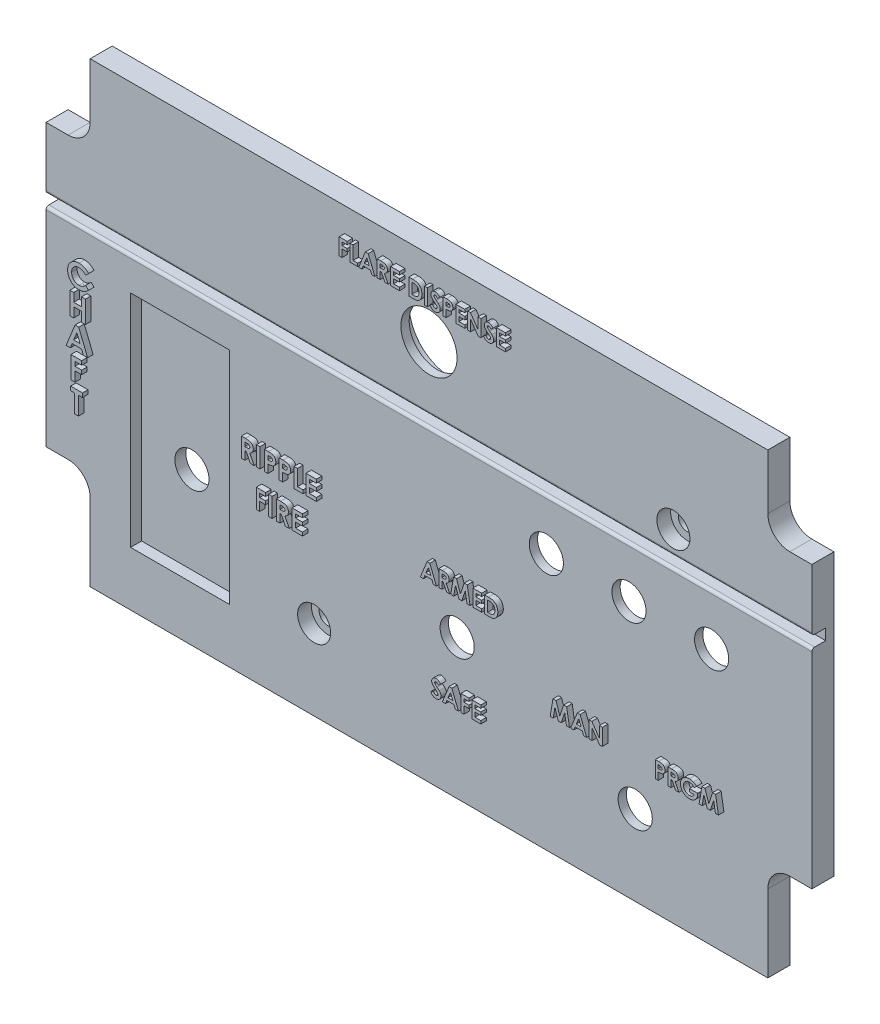
from build123d import *

# Parameters (mm, degrees)
SKETCH1_R           = 1.6
SKETCH1_R_2         = 3.1
SKETCH1_R_3         = 5.1
BOSS_EXTRUDE1_DEPTH = 4
SKETCH4_W           = 0.628205128
SKETCH4_H           = 3.5
SKETCH4_W_2         = 0.538461538
SKETCH4_H_2         = 3
TEXTOS_DEPTH        = 1
SKETCH8_W           = 18.000372339
SKETCH8_H           = 40
CUT_EXTRUDE3_DEPTH  = 2
SKETCH9_W           = 139
SKETCH9_H           = 2
CUT_EXTRUDE4_DEPTH  = 2.5
FILLET1_R           = 0.5
SKETCH10_R          = 3
CUT_EXTRUDE5_DEPTH  = 2.5
SKETCH11_R          = 7.6
SKETCH11_R_2        = 6.7
BACK_HOLES_DEPTH    = 2.5


with BuildPart() as part:
    # Sketch1 → Boss-Extrude1 (new body)
    with BuildSketch(Plane.XY):
        with BuildLine():
            Line((8, 6.645362503), (131, 6.645362503))
            Line((131, 6.645362503), (131, 20.645362503))
            ThreePointArc((131, 20.645362503), (132.171572875, 23.473789627), (135, 24.645362503))
            Line((135, 24.645362503), (139, 24.645362503))
            Line((139, 24.645362503), (139, 75.645362503))
            Line((139, 75.645362503), (135, 75.645362503))
            ThreePointArc((135, 75.645362503), (132.171572875, 76.816935378), (131, 79.645362503))
            Line((131, 79.645362503), (131, 89.645362503))
            Line((131, 89.645362503), (8, 89.645362503))
            Line((8, 89.645362503), (8, 79.645362503))
            ThreePointArc((8, 79.645362503), (6.828427125, 76.816935378), (4, 75.645362503))
            Line((4, 75.645362503), (0, 75.645362503))
            Line((0, 75.645362503), (0, 24.645362503))
            Line((0, 24.645362503), (4, 24.645362503))
            ThreePointArc((4, 24.645362503), (6.828427125, 23.473789627), (8, 20.645362503))
            Line((8, 20.645362503), (8, 6.645362503))
        make_face()
        with Locations((48.65436543, 21.190360986)):
            Circle(SKETCH1_R, mode=Mode.SUBTRACT)
        with Locations((90.80059856, 53.242270362)):
            Circle(SKETCH1_R_2, mode=Mode.SUBTRACT)
        with Locations((105.80059856, 53.242270362)):
            Circle(SKETCH1_R_2, mode=Mode.SUBTRACT)
        with Locations((120.80059856, 53.242270362)):
            Circle(SKETCH1_R_2, mode=Mode.SUBTRACT)
        with Locations((69.5, 75.877173709)):
            Circle(SKETCH1_R_3, mode=Mode.SUBTRACT)
        with Locations((106.932598637, 21.190360986)):
            Circle(SKETCH1_R_2, mode=Mode.SUBTRACT)
        with Locations((74.615565323, 32.006468775)):
            Circle(SKETCH1_R_2, mode=Mode.SUBTRACT)
        with Locations((24.475038928, 32.311997321)):
            Circle(SKETCH1_R_2, mode=Mode.SUBTRACT)
        with Locations((113.858121324, 68.598088655)):
            Circle(SKETCH1_R, mode=Mode.SUBTRACT)
    extrude(amount=BOSS_EXTRUDE1_DEPTH)

    # Sketch4 → Textos (add)
    # profile 1 of 44: a face of its own
    with BuildSketch(Plane.XY.offset(4)):
        with BuildLine():
            Line((8.707762376, 56.720829657), (8.181320069, 56.217624529))
            add(Edge.make_bspline(
                [(8.181320069, 56.217624529), (8.136662943, 56.263800071), (8.049433587, 56.353995372), (7.908874267, 56.473406002), (7.762697692, 56.572918605), (7.613747436, 56.656727485), (7.459344314, 56.720134876), (7.301273649, 56.76634091), (7.138526111, 56.794510983), (7.028384838, 56.797734138), (6.972986735, 56.799355298)],
                knots=[0, 0, 0, 0, 1.115251505, 2.178435587, 3.19620269, 4.182487026, 5.141301733, 6.088180966, 7.038406374, 8, 8, 8, 8], degree=3))
            add(Edge.make_bspline(
                [(6.972986735, 56.799355298), (6.926722588, 56.798074525), (6.83542539, 56.79554706), (6.701377178, 56.777018248), (6.573153136, 56.745509198), (6.450314333, 56.702083889), (6.333222226, 56.645893845), (6.221631317, 56.576982555), (6.11581673, 56.495972385), (6.017176213, 56.403282487), (5.926943335, 56.302011808), (5.847216842, 56.193956234), (5.780433115, 56.079363316), (5.725624797, 55.959393567), (5.682931236, 55.833491706), (5.652442669, 55.701742496), (5.634808897, 55.563989034), (5.632176938, 55.470345256), (5.6308393, 55.422752734)],
                knots=[0, 0, 0, 0, 1.035432265, 2.043311493, 3.022114605, 3.98653278, 4.95457646, 5.923598177, 6.917315552, 7.932509744, 8.948865224, 9.949768934, 10.933144597, 11.912367597, 12.897413939, 13.903909035, 14.934704909, 16, 16, 16, 16], degree=3))
            add(Edge.make_bspline(
                [(5.6308393, 55.422752734), (5.631224792, 55.389348972), (5.631984605, 55.32350947), (5.640302104, 55.226114575), (5.653695238, 55.1316185), (5.673078421, 55.040164384), (5.697317282, 54.951672971), (5.725754985, 54.86538085), (5.761429666, 54.782480384), (5.8010291, 54.702008738), (5.847082785, 54.626161681), (5.896737153, 54.553835218), (5.950579208, 54.485383885), (6.008957689, 54.421087514), (6.0726942, 54.361950913), (6.140141387, 54.306195773), (6.212436992, 54.255217836), (6.288079252, 54.207737753), (6.36772162, 54.166491401), (6.449203214, 54.129130175), (6.53375946, 54.098787304), (6.620360833, 54.074328182), (6.708697852, 54.053529352), (6.799634535, 54.040722873), (6.892382574, 54.031024677), (6.95506468, 54.03042587), (6.98660853, 54.030124529)],
                knots=[0, 0, 0, 0, 1.103660481, 2.175337485, 3.227646561, 4.255952547, 5.262355991, 6.258840057, 7.255597736, 8.242457506, 9.22035537, 10.185017736, 11.140346927, 12.096287581, 13.051739095, 14.01125915, 14.986044842, 15.97314143, 16.960198552, 17.947847494, 18.933482797, 19.925264591, 20.920966487, 21.929612487, 22.958107872, 24, 24, 24, 24], degree=3))
            add(Edge.make_bspline(
                [(6.98660853, 54.030124529), (7.040112321, 54.031672142), (7.145233357, 54.034712801), (7.299513592, 54.058490317), (7.446527286, 54.097602986), (7.563990524, 54.143792776), (7.656019868, 54.189405793), (7.726080448, 54.231595588), (7.798528547, 54.278789505), (7.872160866, 54.332768695), (7.947805621, 54.392885385), (8.024127509, 54.460456243), (8.103080383, 54.533256258), (8.154801629, 54.585215059), (8.181320069, 54.611855298)],
                knots=[0, 0, 0, 0, 1.404581149, 2.759636711, 4.088442092, 5.392261763, 6.066678138, 6.783632037, 7.538459478, 8.336747902, 9.180226004, 10.074962426, 11.012997595, 12, 12, 12, 12], degree=3))
            Line((8.181320069, 54.611855298), (8.691736735, 54.075797606))
            add(Edge.make_bspline(
                [(8.691736735, 54.075797606), (8.655857191, 54.041157032), (8.585827994, 53.973546041), (8.480190894, 53.877544742), (8.374686742, 53.791276902), (8.271864299, 53.711611379), (8.170039226, 53.64086902), (8.069222322, 53.578979176), (7.970554878, 53.524376563), (7.871988033, 53.477982026), (7.772908453, 53.438588246), (7.670967208, 53.404672787), (7.565852655, 53.375981529), (7.456922802, 53.352831452), (7.34519368, 53.334268215), (7.229619653, 53.321738138), (7.110933518, 53.313314584), (7.030426873, 53.312557658), (6.989813659, 53.312175811)],
                knots=[0, 0, 0, 0, 1.244526981, 2.429050516, 3.560637417, 4.644440555, 5.67424972, 6.652764056, 7.595344123, 8.486817594, 9.369275933, 10.254498637, 11.166417451, 12.086725134, 13.032340136, 13.991389299, 14.986715468, 16, 16, 16, 16], degree=3))
            add(Edge.make_bspline(
                [(6.989813659, 53.312175811), (6.915212214, 53.314077551), (6.769237924, 53.317798726), (6.555316408, 53.345370119), (6.35209671, 53.391593074), (6.159084434, 53.456965081), (5.976340955, 53.540474757), (5.803913023, 53.642853697), (5.642078555, 53.763829899), (5.492144853, 53.901985402), (5.356522684, 54.054566558), (5.236648393, 54.21839686), (5.137488374, 54.394281474), (5.055153674, 54.579622023), (4.990769022, 54.775264288), (4.945453141, 54.981419893), (4.917507168, 55.197889784), (4.914449839, 55.345743709), (4.912890582, 55.42115017)],
                knots=[0, 0, 0, 0, 1.078019885, 2.10938526, 3.111377082, 4.085535484, 5.04941344, 6.010039228, 6.978205633, 7.964457913, 8.951525778, 9.924444315, 10.892603023, 11.863865945, 12.85144698, 13.863884204, 14.910567087, 16, 16, 16, 16], degree=3))
            add(Edge.make_bspline(
                [(4.912890582, 55.42115017), (4.913549448, 55.47032962), (4.914855161, 55.567791271), (4.928578324, 55.711360179), (4.947709211, 55.851314184), (4.978058623, 55.986200099), (5.014641846, 56.117835087), (5.060137891, 56.244788429), (5.114474093, 56.367425001), (5.17589907, 56.485950104), (5.245388531, 56.599587273), (5.323015888, 56.707360185), (5.406782709, 56.810100826), (5.498701776, 56.906446152), (5.597437383, 56.997242093), (5.70343531, 57.081996609), (5.816058033, 57.161925174), (5.935610379, 57.234966626), (6.059769766, 57.301036501), (6.186970216, 57.359312953), (6.316899213, 57.408018647), (6.449007405, 57.448418223), (6.583852947, 57.47857365), (6.720473347, 57.501400335), (6.86003108, 57.514160598), (6.953732008, 57.516249535), (7.001031607, 57.517304016)],
                knots=[0, 0, 0, 0, 1.071919942, 2.124283339, 3.142214191, 4.149696895, 5.136002878, 6.119640489, 7.086990633, 8.058538607, 9.028339693, 9.988281803, 10.952401235, 11.916291999, 12.888973767, 13.874849856, 14.873389453, 15.898127285, 16.927174885, 17.938320013, 18.946391617, 19.950418109, 20.947802303, 21.956882652, 22.968648068, 24, 24, 24, 24], degree=3))
            add(Edge.make_bspline(
                [(7.001031607, 57.517304016), (7.041383015, 57.516699561), (7.12166629, 57.515496936), (7.241221557, 57.505471747), (7.359820677, 57.489727289), (7.47703903, 57.465972254), (7.593715079, 57.437772027), (7.708315571, 57.400847718), (7.822648391, 57.359688618), (7.934920399, 57.310491318), (8.045288309, 57.256788022), (8.15116658, 57.195859681), (8.254332898, 57.131455759), (8.352501159, 57.059764549), (8.447510266, 56.983386424), (8.538863409, 56.901965039), (8.625758909, 56.814142858), (8.6802897, 56.752091303), (8.707762376, 56.720829657)],
                knots=[0, 0, 0, 0, 0.996412454, 1.982464992, 2.961075852, 3.949442424, 4.934965278, 5.923860011, 6.921385422, 7.934793307, 8.949617135, 9.951082467, 10.950285876, 11.951772932, 12.951063433, 13.960125323, 14.972308753, 16, 16, 16, 16], degree=3))
        make_face()
    # profile 2 of 44: a face of its own
    with BuildSketch(Plane.XY.offset(4)):
        Polygon((5.452719363, 37.414739913), (7.606565517, 37.414739913), (7.606565517, 36.696791196), (6.888616799, 36.696791196), (6.888616799, 33.414739913), (6.170668081, 33.414739913), (6.170668081, 36.696791196), (5.452719363, 36.696791196), align=None)
    # profile 3 of 44: a face of its own
    with BuildSketch(Plane.XY.offset(4)):
        with BuildLine():
            Line((36.456474262, 45.071925592), (37.188445415, 45.071925592))
            add(Edge.make_bspline(
                [(37.188445415, 45.071925592), (37.236828486, 45.07175386), (37.329882759, 45.071423571), (37.464061939, 45.066212481), (37.587323968, 45.058960822), (37.699851347, 45.047894598), (37.801595935, 45.033222122), (37.892659704, 45.015925702), (37.973039992, 44.996212722), (38.043414697, 44.971648794), (38.106924387, 44.943941056), (38.166124248, 44.912104356), (38.222320317, 44.876493207), (38.275136983, 44.836170583), (38.325033236, 44.791861878), (38.372103208, 44.743522491), (38.415681757, 44.690742524), (38.455499042, 44.633855479), (38.491789293, 44.574011613), (38.523862263, 44.511128758), (38.549944055, 44.445163185), (38.572990115, 44.377068238), (38.589589445, 44.305870487), (38.601134036, 44.232263053), (38.609586535, 44.155986832), (38.610072513, 44.104168154), (38.610320415, 44.077734887)],
                knots=[0, 0, 0, 0, 1.749336639, 3.364467119, 4.854658419, 6.213483162, 7.451590619, 8.570285859, 9.5643256, 10.440900261, 11.26203566, 12.067320669, 12.869050712, 13.665104639, 14.467235401, 15.27997916, 16.102287765, 16.939272006, 17.78853747, 18.631303466, 19.488103222, 20.351255419, 21.228522269, 22.127379805, 23.044756219, 24, 24, 24, 24], degree=3))
            add(Edge.make_bspline(
                [(38.610320415, 44.077734887), (38.609676453, 44.050144629), (38.608413761, 43.99604516), (38.601612212, 43.916577453), (38.589181118, 43.84054831), (38.570352418, 43.768180334), (38.548711272, 43.698572821), (38.519934099, 43.633010075), (38.487456216, 43.570538579), (38.448883183, 43.512042016), (38.406551163, 43.456221062), (38.357319915, 43.405214423), (38.304378867, 43.356280687), (38.24475201, 43.312484896), (38.18106775, 43.270865737), (38.11206075, 43.233147696), (38.038181372, 43.198382627), (37.98624051, 43.178995223), (37.95967939, 43.169081041)],
                knots=[0, 0, 0, 0, 1.099860209, 2.156625411, 3.176576793, 4.16617041, 5.135385252, 6.078461593, 7.016046972, 7.938469504, 8.868247731, 9.803980173, 10.76021508, 11.73834243, 12.748633912, 13.790971185, 14.870363756, 16, 16, 16, 16], degree=3))
            Line((37.95967939, 43.169081041), (38.767371698, 41.571925592))
            Line((38.767371698, 41.571925592), (38.06905439, 41.571925592))
            Line((38.06905439, 41.571925592), (37.297820415, 43.097566618))
            Line((37.297820415, 43.097566618), (37.08467939, 43.097566618))
            Line((37.08467939, 43.097566618), (37.08467939, 41.571925592))
            Line((37.08467939, 41.571925592), (36.456474262, 41.571925592))
            Line((36.456474262, 41.571925592), (36.456474262, 45.071925592))
        make_face()
        with BuildLine():
            Line((37.08467939, 43.725771746), (37.329370896, 43.725771746))
            add(Edge.make_bspline(
                [(37.329370896, 43.725771746), (37.359286467, 43.726108675), (37.416568357, 43.726753823), (37.498947238, 43.729746282), (37.573766908, 43.736956632), (37.641348668, 43.746066639), (37.702032584, 43.756585458), (37.755277376, 43.771659564), (37.801903466, 43.787811851), (37.841358332, 43.807884953), (37.875067663, 43.830712424), (37.904173512, 43.856644998), (37.928248223, 43.88665865), (37.948062938, 43.91993774), (37.963476632, 43.956776611), (37.974727448, 43.996770857), (37.98101499, 44.040376064), (37.981738394, 44.070469594), (37.982115287, 44.086148349)],
                knots=[0, 0, 0, 0, 1.688639943, 3.233382647, 4.650958383, 5.928841754, 7.082724185, 8.122798841, 9.049171256, 9.863274652, 10.613301712, 11.341792392, 12.054588806, 12.776240173, 13.521029143, 14.301969904, 15.115324896, 16, 16, 16, 16], degree=3))
            add(Edge.make_bspline(
                [(37.982115287, 44.086148349), (37.981402735, 44.10469746), (37.980003059, 44.141133751), (37.966113922, 44.193589235), (37.944005415, 44.242140374), (37.913700708, 44.286567802), (37.875535869, 44.325515953), (37.831738705, 44.359849058), (37.781363968, 44.386997108), (37.734720752, 44.404903673), (37.692286328, 44.415617356), (37.653990599, 44.423601097), (37.609643914, 44.429259404), (37.559212795, 44.435261045), (37.502825791, 44.439152806), (37.440175559, 44.441993016), (37.371442032, 44.443155085), (37.323528235, 44.443526578), (37.298521537, 44.443720464)],
                knots=[0, 0, 0, 0, 1.020303359, 2.004196876, 2.966617323, 3.9489082, 4.950758222, 5.960522915, 7.003732012, 8.091992268, 8.70421221, 9.413913587, 10.24622431, 11.166358409, 12.212345909, 13.359657661, 14.621978493, 16, 16, 16, 16], degree=3))
            Line((37.298521537, 44.443720464), (37.08467939, 44.443720464))
            Line((37.08467939, 44.443720464), (37.08467939, 43.725771746))
        make_face(mode=Mode.SUBTRACT)
    # profile 4 of 44: a face of its own
    with BuildSketch(Plane.XY.offset(4)):
        with Locations((39.507756313, 43.321925592)):
            Rectangle(SKETCH4_W, SKETCH4_H)
    # profile 5 of 44: a face of its own
    with BuildSketch(Plane.XY.offset(4)):
        with BuildLine():
            Line((40.629551185, 45.071925592), (41.33067298, 45.071925592))
            add(Edge.make_bspline(
                [(41.33067298, 45.071925592), (41.376483368, 45.071720535), (41.46486121, 45.071324937), (41.592309329, 45.066527785), (41.709886459, 45.057930996), (41.817565587, 45.047306724), (41.915302438, 45.032411908), (42.003219408, 45.015336168), (42.081334741, 44.994532946), (42.150529304, 44.969839811), (42.212629189, 44.940727569), (42.271395709, 44.909720953), (42.325500735, 44.872715651), (42.377675111, 44.833699937), (42.424935937, 44.788946654), (42.470231626, 44.741434199), (42.511643784, 44.689278266), (42.549364298, 44.633110189), (42.583582616, 44.573967714), (42.613478028, 44.511745112), (42.637727512, 44.446343922), (42.658069814, 44.378187216), (42.674408948, 44.307277963), (42.685284797, 44.233180066), (42.69267222, 44.156410904), (42.693324058, 44.104161764), (42.693653749, 44.077734887)],
                knots=[0, 0, 0, 0, 1.698747864, 3.27724071, 4.728299578, 6.070144658, 7.288476769, 8.393259625, 9.389771311, 10.283485332, 11.113357557, 11.931608583, 12.74405601, 13.541433047, 14.344816069, 15.154114104, 15.974336324, 16.810834471, 17.661136416, 18.50621059, 19.367396281, 20.244825668, 21.142564693, 22.063065223, 23.020325768, 24, 24, 24, 24], degree=3))
            add(Edge.make_bspline(
                [(42.693653749, 44.077734887), (42.693176728, 44.048499463), (42.692239323, 43.991048262), (42.683049737, 43.906831849), (42.66735102, 43.826539124), (42.646833618, 43.749492965), (42.618223561, 43.67696095), (42.585537913, 43.607212445), (42.545324199, 43.542202983), (42.499373603, 43.481119374), (42.449190309, 43.423464979), (42.393582968, 43.370904461), (42.333611481, 43.323079515), (42.269623001, 43.279488933), (42.201377296, 43.240220646), (42.128923608, 43.20490695), (42.051767183, 43.174677284), (41.99803777, 43.158867414), (41.970797178, 43.150851874)],
                knots=[0, 0, 0, 0, 1.102006807, 2.165578795, 3.188629044, 4.184801286, 5.166646146, 6.124351954, 7.085497154, 8.042432466, 9.003981491, 9.963833307, 10.922997304, 11.89326795, 12.880200226, 13.889073926, 14.929769137, 16, 16, 16, 16], degree=3))
            add(Edge.make_bspline(
                [(41.970797178, 43.150851874), (41.952854957, 43.146387821), (41.913986329, 43.136717243), (41.849669425, 43.12689918), (41.775550947, 43.117872074), (41.691391219, 43.110114369), (41.597141724, 43.104840938), (41.492893718, 43.100722623), (41.378599958, 43.097728182), (41.299124597, 43.097621926), (41.257756313, 43.097566618)],
                knots=[0, 0, 0, 0, 0.618981996, 1.340914327, 2.176866532, 3.120127938, 4.170906482, 5.338178032, 6.614476169, 8, 8, 8, 8], degree=3))
            Line((41.257756313, 43.097566618), (41.257756313, 41.571925592))
            Line((41.257756313, 41.571925592), (40.629551185, 41.571925592))
            Line((40.629551185, 41.571925592), (40.629551185, 45.071925592))
        make_face()
        with BuildLine():
            Line((41.257756313, 43.725771746), (41.480011922, 43.725771746))
            add(Edge.make_bspline(
                [(41.480011922, 43.725771746), (41.520454839, 43.726028186), (41.594870407, 43.726500038), (41.696495794, 43.733323299), (41.77816391, 43.743743797), (41.842683239, 43.7586892), (41.893627359, 43.781370829), (41.937563474, 43.807609202), (41.975248601, 43.840786904), (42.007878375, 43.878698106), (42.033964895, 43.922259978), (42.052054539, 43.970763198), (42.063805215, 44.023188662), (42.0648905, 44.059673315), (42.065448621, 44.078436009)],
                knots=[0, 0, 0, 0, 1.8619151, 3.425951444, 4.686033666, 5.651700536, 6.461346321, 7.243864085, 7.999046032, 8.762387399, 9.539336099, 10.322741239, 11.137448474, 12, 12, 12, 12], degree=3))
            add(Edge.make_bspline(
                [(42.065448621, 44.078436009), (42.064896241, 44.094828731), (42.06382449, 44.126634552), (42.055951122, 44.172538241), (42.043403239, 44.215329949), (42.025221837, 44.254562772), (42.001717591, 44.290170049), (41.973061157, 44.322137752), (41.939620256, 44.351150496), (41.913801925, 44.366507385), (41.900684999, 44.374309406)],
                knots=[0, 0, 0, 0, 1.102301479, 2.1387299, 3.123554645, 4.094223062, 5.036071848, 5.982632524, 6.975082478, 8, 8, 8, 8], degree=3))
            add(Edge.make_bspline(
                [(41.900684999, 44.374309406), (41.889574205, 44.379928453), (41.866050379, 44.391825127), (41.825987021, 44.40565588), (41.779754518, 44.417323644), (41.727040749, 44.427007775), (41.668056003, 44.434523667), (41.602810805, 44.440271443), (41.531209139, 44.442582848), (41.481414465, 44.4433308), (41.455472659, 44.443720464)],
                knots=[0, 0, 0, 0, 0.656809284, 1.390599849, 2.23162475, 3.173112763, 4.218524733, 5.370385145, 6.63003504, 8, 8, 8, 8], degree=3))
            Line((41.455472659, 44.443720464), (41.257756313, 44.443720464))
            Line((41.257756313, 44.443720464), (41.257756313, 43.725771746))
        make_face(mode=Mode.SUBTRACT)
    # profile 6 of 44: a face of its own
    with BuildSketch(Plane.XY.offset(4)):
        with BuildLine():
            Line((43.321858877, 45.071925592), (44.022980672, 45.071925592))
            add(Edge.make_bspline(
                [(44.022980672, 45.071925592), (44.06879106, 45.071720535), (44.157168902, 45.071324937), (44.284617022, 45.066527785), (44.402194152, 45.057930996), (44.50987328, 45.047306724), (44.60761013, 45.032411908), (44.6955271, 45.015336168), (44.773642433, 44.994532946), (44.842836996, 44.969839811), (44.904936881, 44.940727569), (44.963703402, 44.909720953), (45.017808428, 44.872715651), (45.069982803, 44.833699937), (45.117243629, 44.788946654), (45.162539319, 44.741434199), (45.203951476, 44.689278266), (45.24167199, 44.633110189), (45.275890308, 44.573967714), (45.30578572, 44.511745112), (45.330035204, 44.446343922), (45.350377506, 44.378187216), (45.366716641, 44.307277963), (45.377592489, 44.233180066), (45.384979913, 44.156410904), (45.385631751, 44.104161764), (45.385961441, 44.077734887)],
                knots=[0, 0, 0, 0, 1.698747864, 3.27724071, 4.728299578, 6.070144658, 7.288476769, 8.393259625, 9.389771311, 10.283485332, 11.113357557, 11.931608583, 12.74405601, 13.541433047, 14.344816069, 15.154114104, 15.974336324, 16.810834471, 17.661136416, 18.50621059, 19.367396281, 20.244825668, 21.142564693, 22.063065223, 23.020325768, 24, 24, 24, 24], degree=3))
            add(Edge.make_bspline(
                [(45.385961441, 44.077734887), (45.38548442, 44.048499463), (45.384547016, 43.991048262), (45.375357429, 43.906831849), (45.359658712, 43.826539124), (45.339141311, 43.749492965), (45.310531253, 43.67696095), (45.277845606, 43.607212445), (45.237631892, 43.542202983), (45.191681295, 43.481119374), (45.141498001, 43.423464979), (45.085890661, 43.370904461), (45.025919174, 43.323079515), (44.961930693, 43.279488933), (44.893684988, 43.240220646), (44.821231301, 43.20490695), (44.744074876, 43.174677284), (44.690345463, 43.158867414), (44.663104871, 43.150851874)],
                knots=[0, 0, 0, 0, 1.102006807, 2.165578795, 3.188629044, 4.184801286, 5.166646146, 6.124351954, 7.085497154, 8.042432466, 9.003981491, 9.963833307, 10.922997304, 11.89326795, 12.880200226, 13.889073926, 14.929769137, 16, 16, 16, 16], degree=3))
            add(Edge.make_bspline(
                [(44.663104871, 43.150851874), (44.64516265, 43.146387821), (44.606294021, 43.136717243), (44.541977118, 43.12689918), (44.467858639, 43.117872074), (44.383698912, 43.110114369), (44.289449416, 43.104840938), (44.18520141, 43.100722623), (44.07090765, 43.097728182), (43.991432289, 43.097621926), (43.950064005, 43.097566618)],
                knots=[0, 0, 0, 0, 0.618981996, 1.340914327, 2.176866532, 3.120127938, 4.170906482, 5.338178032, 6.614476169, 8, 8, 8, 8], degree=3))
            Line((43.950064005, 43.097566618), (43.950064005, 41.571925592))
            Line((43.950064005, 41.571925592), (43.321858877, 41.571925592))
            Line((43.321858877, 41.571925592), (43.321858877, 45.071925592))
        make_face()
        with BuildLine():
            Line((43.950064005, 43.725771746), (44.172319614, 43.725771746))
            add(Edge.make_bspline(
                [(44.172319614, 43.725771746), (44.212762531, 43.726028186), (44.287178099, 43.726500038), (44.388803487, 43.733323299), (44.470471603, 43.743743797), (44.534990931, 43.7586892), (44.585935052, 43.781370829), (44.629871166, 43.807609202), (44.667556294, 43.840786904), (44.700186067, 43.878698106), (44.726272588, 43.922259978), (44.744362231, 43.970763198), (44.756112908, 44.023188662), (44.757198192, 44.059673315), (44.757756313, 44.078436009)],
                knots=[0, 0, 0, 0, 1.8619151, 3.425951444, 4.686033666, 5.651700536, 6.461346321, 7.243864085, 7.999046032, 8.762387399, 9.539336099, 10.322741239, 11.137448474, 12, 12, 12, 12], degree=3))
            add(Edge.make_bspline(
                [(44.757756313, 44.078436009), (44.757203933, 44.094828731), (44.756132183, 44.126634552), (44.748258815, 44.172538241), (44.735710931, 44.215329949), (44.71752953, 44.254562772), (44.694025283, 44.290170049), (44.66536885, 44.322137752), (44.631927948, 44.351150496), (44.606109617, 44.366507385), (44.592992691, 44.374309406)],
                knots=[0, 0, 0, 0, 1.102301479, 2.1387299, 3.123554645, 4.094223062, 5.036071848, 5.982632524, 6.975082478, 8, 8, 8, 8], degree=3))
            add(Edge.make_bspline(
                [(44.592992691, 44.374309406), (44.581881898, 44.379928453), (44.558358071, 44.391825127), (44.518294713, 44.40565588), (44.472062211, 44.417323644), (44.419348441, 44.427007775), (44.360363695, 44.434523667), (44.295118497, 44.440271443), (44.223516831, 44.442582848), (44.173722157, 44.4433308), (44.147780351, 44.443720464)],
                knots=[0, 0, 0, 0, 0.656809284, 1.390599849, 2.23162475, 3.173112763, 4.218524733, 5.370385145, 6.63003504, 8, 8, 8, 8], degree=3))
            Line((44.147780351, 44.443720464), (43.950064005, 44.443720464))
            Line((43.950064005, 44.443720464), (43.950064005, 43.725771746))
        make_face(mode=Mode.SUBTRACT)
    # profile 7 of 44: a face of its own
    with BuildSketch(Plane.XY.offset(4)):
        Polygon((46.014166569, 45.071925592), (46.642371698, 45.071925592), (46.642371698, 42.200130721), (47.629551185, 42.200130721), (47.629551185, 41.571925592), (46.014166569, 41.571925592), align=None)
    # profile 8 of 44: a face of its own
    with BuildSketch(Plane.XY.offset(4)):
        Polygon((48.168012723, 45.071925592), (50.052628108, 45.071925592), (50.052628108, 44.443720464), (48.796217851, 44.443720464), (48.796217851, 43.770643541), (50.052628108, 43.770643541), (50.052628108, 43.142438413), (48.796217851, 43.142438413), (48.796217851, 42.200130721), (50.052628108, 42.200130721), (50.052628108, 41.571925592), (48.168012723, 41.571925592), align=None)
    # profile 9 of 44: a face of its own
    with BuildSketch(Plane.XY.offset(4)):
        Polygon((39.148781954, 38.373207644), (40.853910159, 38.373207644), (40.853910159, 37.745002515), (39.776987082, 37.745002515), (39.776987082, 37.071925592), (40.853910159, 37.071925592), (40.853910159, 36.443720464), (39.776987082, 36.443720464), (39.776987082, 34.873207644), (39.148781954, 34.873207644), align=None)
    # profile 10 of 44: a face of its own
    with BuildSketch(Plane.XY.offset(4)):
        with Locations((41.706474262, 36.623207644)):
            Rectangle(SKETCH4_W, SKETCH4_H)
    # profile 11 of 44: a face of its own
    with BuildSketch(Plane.XY.offset(4)):
        with BuildLine():
            Line((42.828269133, 38.373207644), (43.560240287, 38.373207644))
            add(Edge.make_bspline(
                [(43.560240287, 38.373207644), (43.608623358, 38.373035911), (43.701677631, 38.372705622), (43.835856811, 38.367494533), (43.95911884, 38.360242873), (44.071646219, 38.349176649), (44.173390807, 38.334504174), (44.264454576, 38.317207753), (44.344834864, 38.297494773), (44.415209568, 38.272930845), (44.478719259, 38.245223107), (44.53791912, 38.213386407), (44.594115189, 38.177775259), (44.646931855, 38.137452635), (44.696828108, 38.09314393), (44.74389808, 38.044804543), (44.787476629, 37.992024576), (44.827293914, 37.935137531), (44.863584165, 37.875293664), (44.895657135, 37.812410809), (44.921738927, 37.746445236), (44.944784987, 37.678350289), (44.961384317, 37.607152538), (44.972928908, 37.533545105), (44.981381406, 37.457268884), (44.981867385, 37.405450206), (44.982115287, 37.379016938)],
                knots=[0, 0, 0, 0, 1.749336639, 3.364467119, 4.854658419, 6.213483162, 7.451590619, 8.570285859, 9.5643256, 10.440900261, 11.26203566, 12.067320669, 12.869050712, 13.665104639, 14.467235401, 15.27997916, 16.102287765, 16.939272006, 17.78853747, 18.631303466, 19.488103222, 20.351255419, 21.228522269, 22.127379805, 23.044756219, 24, 24, 24, 24], degree=3))
            add(Edge.make_bspline(
                [(44.982115287, 37.379016938), (44.981471325, 37.35142668), (44.980208633, 37.297327211), (44.973407084, 37.217859504), (44.96097599, 37.141830361), (44.942147289, 37.069462385), (44.920506144, 36.999854873), (44.891728971, 36.934292126), (44.859251088, 36.87182063), (44.820678055, 36.813324067), (44.778346035, 36.757503113), (44.729114787, 36.706496474), (44.676173739, 36.657562738), (44.616546881, 36.613766947), (44.552862622, 36.572147788), (44.483855622, 36.534429747), (44.409976243, 36.499664678), (44.358035382, 36.480277274), (44.331474262, 36.470363092)],
                knots=[0, 0, 0, 0, 1.099860209, 2.156625411, 3.176576793, 4.16617041, 5.135385252, 6.078461593, 7.016046972, 7.938469504, 8.868247731, 9.803980173, 10.76021508, 11.73834243, 12.748633912, 13.790971185, 14.870363756, 16, 16, 16, 16], degree=3))
            Line((44.331474262, 36.470363092), (45.139166569, 34.873207644))
            Line((45.139166569, 34.873207644), (44.440849262, 34.873207644))
            Line((44.440849262, 34.873207644), (43.669615287, 36.398848669))
            Line((43.669615287, 36.398848669), (43.456474262, 36.398848669))
            Line((43.456474262, 36.398848669), (43.456474262, 34.873207644))
            Line((43.456474262, 34.873207644), (42.828269133, 34.873207644))
            Line((42.828269133, 34.873207644), (42.828269133, 38.373207644))
        make_face()
        with BuildLine():
            Line((43.456474262, 37.027053797), (43.701165768, 37.027053797))
            add(Edge.make_bspline(
                [(43.701165768, 37.027053797), (43.731081339, 37.027390727), (43.788363228, 37.028035874), (43.870742109, 37.031028334), (43.94556178, 37.038238683), (44.01314354, 37.047348691), (44.073827456, 37.057867509), (44.127072248, 37.072941616), (44.173698338, 37.089093902), (44.213153204, 37.109167004), (44.246862534, 37.131994475), (44.275968384, 37.157927049), (44.300043095, 37.187940702), (44.31985781, 37.221219791), (44.335271504, 37.258058662), (44.34652232, 37.298052908), (44.352809862, 37.341658115), (44.353533265, 37.371751646), (44.353910159, 37.3874304)],
                knots=[0, 0, 0, 0, 1.688639943, 3.233382647, 4.650958383, 5.928841754, 7.082724185, 8.122798841, 9.049171256, 9.863274652, 10.613301712, 11.341792392, 12.054588806, 12.776240173, 13.521029143, 14.301969904, 15.115324896, 16, 16, 16, 16], degree=3))
            add(Edge.make_bspline(
                [(44.353910159, 37.3874304), (44.353197607, 37.405979511), (44.351797931, 37.442415803), (44.337908793, 37.494871286), (44.315800287, 37.543422425), (44.285495579, 37.587849854), (44.24733074, 37.626798004), (44.203533577, 37.661131109), (44.153158839, 37.688279159), (44.106515624, 37.706185724), (44.0640812, 37.716899407), (44.025785471, 37.724883148), (43.981438786, 37.730541455), (43.931007667, 37.736543097), (43.874620662, 37.740434857), (43.811970431, 37.743275067), (43.743236903, 37.744437136), (43.695323107, 37.744808629), (43.670316409, 37.745002515)],
                knots=[0, 0, 0, 0, 1.020303359, 2.004196876, 2.966617323, 3.9489082, 4.950758222, 5.960522915, 7.003732012, 8.091992268, 8.70421221, 9.413913587, 10.24622431, 11.166358409, 12.212345909, 13.359657661, 14.621978493, 16, 16, 16, 16], degree=3))
            Line((43.670316409, 37.745002515), (43.456474262, 37.745002515))
            Line((43.456474262, 37.745002515), (43.456474262, 37.027053797))
        make_face(mode=Mode.SUBTRACT)
    # profile 12 of 44: a face of its own
    with BuildSketch(Plane.XY.offset(4)):
        Polygon((45.65519221, 38.373207644), (47.539807595, 38.373207644), (47.539807595, 37.745002515), (46.283397339, 37.745002515), (46.283397339, 37.071925592), (47.539807595, 37.071925592), (47.539807595, 36.443720464), (46.283397339, 36.443720464), (46.283397339, 35.501412772), (47.539807595, 35.501412772), (47.539807595, 34.873207644), (45.65519221, 34.873207644), align=None)
    # profile 13 of 44: a face of its own
    with BuildSketch(Plane.XY.offset(4)):
        Polygon((5.513487609, 42.414739913), (7.462205558, 42.414739913), (7.462205558, 41.696791196), (6.231436327, 41.696791196), (6.231436327, 40.927560426), (7.462205558, 40.927560426), (7.462205558, 40.209611708), (6.231436327, 40.209611708), (6.231436327, 38.414739913), (5.513487609, 38.414739913), align=None)
    # profile 14 of 44: a face of its own
    with BuildSketch(Plane.XY.offset(4)):
        Polygon((54.186167264, 85.254182766), (55.647705725, 85.254182766), (55.647705725, 84.715721228), (54.724628802, 84.715721228), (54.724628802, 84.138798151), (55.647705725, 84.138798151), (55.647705725, 83.600336612), (54.724628802, 83.600336612), (54.724628802, 82.254182766), (54.186167264, 82.254182766), align=None)
    # profile 15 of 44: a face of its own
    with BuildSketch(Plane.XY.offset(4)):
        Polygon((56.186167264, 85.254182766), (56.724628802, 85.254182766), (56.724628802, 82.792644305), (57.570782648, 82.792644305), (57.570782648, 82.254182766), (56.186167264, 82.254182766), align=None)
    # profile 16 of 44: a face of its own
    with BuildSketch(Plane.XY.offset(4)):
        Polygon((58.954797071, 85.254182766), (59.455398033, 85.254182766), (60.666936494, 82.254182766), (60.091816302, 82.254182766), (59.858643225, 82.869567382), (58.552753802, 82.869567382), (58.318979764, 82.254182766), (57.743859571, 82.254182766), align=None)
        Polygon((59.205398033, 84.449495266), (58.757080725, 83.40802892), (59.654316302, 83.40802892), align=None, mode=Mode.SUBTRACT)
    # profile 17 of 44: a face of its own
    with BuildSketch(Plane.XY.offset(4)):
        with BuildLine():
            Line((61.109244187, 85.254182766), (61.736648033, 85.254182766))
            add(Edge.make_bspline(
                [(61.736648033, 85.254182766), (61.778119236, 85.254035567), (61.857880042, 85.253752462), (61.972890767, 85.249285814), (62.078543935, 85.243070106), (62.174995974, 85.233584771), (62.262205621, 85.221008363), (62.34026028, 85.20618286), (62.40915767, 85.18928602), (62.469478845, 85.168231225), (62.523915723, 85.144481735), (62.574658461, 85.117193135), (62.62282652, 85.086669293), (62.668097948, 85.052107044), (62.710866165, 85.014128154), (62.751211855, 84.972694394), (62.788564897, 84.927454422), (62.822693999, 84.878694098), (62.853799928, 84.827399355), (62.881291045, 84.773499765), (62.903646867, 84.716957845), (62.923400632, 84.658590748), (62.93762863, 84.597564104), (62.947523994, 84.534472019), (62.954768992, 84.4690924), (62.955185545, 84.424676391), (62.955398033, 84.402019305)],
                knots=[0, 0, 0, 0, 1.749336639, 3.364467119, 4.854658419, 6.213483162, 7.451590619, 8.570285859, 9.5643256, 10.440900261, 11.26203566, 12.067320669, 12.869050712, 13.665104639, 14.467235401, 15.27997916, 16.102287765, 16.939272006, 17.78853747, 18.631303466, 19.488103222, 20.351255419, 21.228522269, 22.127379805, 23.044756219, 24, 24, 24, 24], degree=3))
            add(Edge.make_bspline(
                [(62.955398033, 84.402019305), (62.954846065, 84.378370512), (62.953763757, 84.331999539), (62.947933859, 84.263884361), (62.937278635, 84.198716524), (62.921139749, 84.13668683), (62.902590195, 84.077023248), (62.877924048, 84.020826608), (62.850085862, 83.967279611), (62.817023262, 83.917139701), (62.780738674, 83.869293168), (62.738540461, 83.825573192), (62.69316242, 83.78362999), (62.642053685, 83.74609074), (62.587467177, 83.710417176), (62.528318319, 83.678087426), (62.464993138, 83.648288796), (62.4204724, 83.631671021), (62.397705725, 83.623173151)],
                knots=[0, 0, 0, 0, 1.099860209, 2.156625411, 3.176576793, 4.16617041, 5.135385252, 6.078461593, 7.016046972, 7.938469504, 8.868247731, 9.803980173, 10.76021508, 11.73834243, 12.748633912, 13.790971185, 14.870363756, 16, 16, 16, 16], degree=3))
            Line((62.397705725, 83.623173151), (63.090013417, 82.254182766))
            Line((63.090013417, 82.254182766), (62.491455725, 82.254182766))
            Line((62.491455725, 82.254182766), (61.830398033, 83.561875074))
            Line((61.830398033, 83.561875074), (61.647705725, 83.561875074))
            Line((61.647705725, 83.561875074), (61.647705725, 82.254182766))
            Line((61.647705725, 82.254182766), (61.109244187, 82.254182766))
            Line((61.109244187, 82.254182766), (61.109244187, 85.254182766))
        make_face()
        with BuildLine():
            Line((61.647705725, 84.100336612), (61.857441302, 84.100336612))
            add(Edge.make_bspline(
                [(61.857441302, 84.100336612), (61.88308322, 84.100625409), (61.932181982, 84.101178392), (62.002792452, 84.103743358), (62.066923598, 84.109923657), (62.124850821, 84.117732235), (62.176865606, 84.126748365), (62.222503999, 84.139669028), (62.262469219, 84.153513845), (62.296287675, 84.170719361), (62.325181387, 84.190285764), (62.350129259, 84.212513685), (62.370764725, 84.238239673), (62.387748767, 84.266764607), (62.400960504, 84.298340782), (62.410604061, 84.332621565), (62.415993383, 84.369997456), (62.416613443, 84.395791911), (62.416936494, 84.409230843)],
                knots=[0, 0, 0, 0, 1.688639943, 3.233382647, 4.650958383, 5.928841754, 7.082724185, 8.122798841, 9.049171256, 9.863274652, 10.613301712, 11.341792392, 12.054588806, 12.776240173, 13.521029143, 14.301969904, 15.115324896, 16, 16, 16, 16], degree=3))
            add(Edge.make_bspline(
                [(62.416936494, 84.409230843), (62.416325736, 84.425130081), (62.415126013, 84.456361188), (62.403221038, 84.501323031), (62.384270889, 84.542938293), (62.358295426, 84.581018946), (62.325582707, 84.614403075), (62.288042281, 84.643831451), (62.244863935, 84.667101208), (62.204884035, 84.682449693), (62.168511672, 84.691632849), (62.135686761, 84.698476056), (62.097675318, 84.703326033), (62.054448644, 84.708470297), (62.006116926, 84.711806092), (61.952416728, 84.714240558), (61.893502275, 84.715236617), (61.852433307, 84.71555504), (61.830998994, 84.715721228)],
                knots=[0, 0, 0, 0, 1.020303359, 2.004196876, 2.966617323, 3.9489082, 4.950758222, 5.960522915, 7.003732012, 8.091992268, 8.70421221, 9.413913587, 10.24622431, 11.166358409, 12.212345909, 13.359657661, 14.621978493, 16, 16, 16, 16], degree=3))
            Line((61.830998994, 84.715721228), (61.647705725, 84.715721228))
            Line((61.647705725, 84.715721228), (61.647705725, 84.100336612))
        make_face(mode=Mode.SUBTRACT)
    # profile 18 of 44: a face of its own
    with BuildSketch(Plane.XY.offset(4)):
        Polygon((63.53232111, 85.254182766), (65.147705725, 85.254182766), (65.147705725, 84.715721228), (64.070782648, 84.715721228), (64.070782648, 84.138798151), (65.147705725, 84.138798151), (65.147705725, 83.600336612), (64.070782648, 83.600336612), (64.070782648, 82.792644305), (65.147705725, 82.792644305), (65.147705725, 82.254182766), (63.53232111, 82.254182766), align=None)
    # profile 19 of 44: a face of its own
    with BuildSketch(Plane.XY.offset(4)):
        with BuildLine():
            Line((66.840013417, 85.254182766), (67.518498994, 85.254182766))
            add(Edge.make_bspline(
                [(67.518498994, 85.254182766), (67.571394749, 85.253813007), (67.673642841, 85.253098258), (67.821780098, 85.245044753), (67.959528896, 85.232659036), (68.086978031, 85.215620237), (68.203866212, 85.193073239), (68.310042712, 85.164792451), (68.405863888, 85.132146985), (68.492380397, 85.093732969), (68.571361648, 85.048946043), (68.646356867, 84.999057002), (68.717218802, 84.942238266), (68.784941888, 84.879585982), (68.848652145, 84.809953944), (68.909410576, 84.734495512), (68.96572954, 84.652116435), (69.019311437, 84.564791903), (69.067769133, 84.472151842), (69.110035746, 84.374984787), (69.145442744, 84.273916042), (69.174212763, 84.168837896), (69.197145789, 84.060099175), (69.213191565, 83.947480455), (69.223111223, 83.831086002), (69.22411749, 83.752199766), (69.224628802, 83.712115458)],
                knots=[0, 0, 0, 0, 1.44355588, 2.790409838, 4.047694926, 5.217575253, 6.298404546, 7.294384826, 8.214239204, 9.058592145, 9.873746385, 10.689560431, 11.514393297, 12.350027578, 13.205127629, 14.088021785, 14.991911688, 15.926770944, 16.882954281, 17.842803888, 18.816321264, 19.80318086, 20.814351908, 21.847355356, 22.906180909, 24, 24, 24, 24], degree=3))
            add(Edge.make_bspline(
                [(69.224628802, 83.712115458), (69.223289911, 83.655553891), (69.220654225, 83.544209134), (69.198452679, 83.380811987), (69.162545262, 83.224179524), (69.112056172, 83.075536985), (69.049463216, 82.936208055), (68.974688921, 82.808649741), (68.888829653, 82.69354671), (68.792885676, 82.591472082), (68.689001716, 82.503737555), (68.581045334, 82.428599354), (68.467964837, 82.369346612), (68.368325116, 82.331771514), (68.281925047, 82.308403053), (68.206066721, 82.294592068), (68.119899402, 82.281926561), (68.022619656, 82.27213893), (67.914654228, 82.263410769), (67.795572766, 82.258668226), (67.665760821, 82.254727876), (67.575594151, 82.254369231), (67.52871534, 82.254182766)],
                knots=[0, 0, 0, 0, 1.315458931, 2.589557908, 3.828601765, 5.048913369, 6.235739168, 7.376350998, 8.481830359, 9.569842114, 10.627874879, 11.640079404, 12.624025415, 13.590060155, 14.111227486, 14.704434459, 15.382649715, 16.137166398, 16.978595427, 17.902333227, 18.909396075, 20, 20, 20, 20], degree=3))
            Line((67.52871534, 82.254182766), (66.840013417, 82.254182766))
            Line((66.840013417, 82.254182766), (66.840013417, 85.254182766))
        make_face()
        with BuildLine():
            Line((67.378474956, 84.715721228), (67.378474956, 82.792644305))
            Line((67.378474956, 82.792644305), (67.659724956, 82.792644305))
            add(Edge.make_bspline(
                [(67.659724956, 82.792644305), (67.693189387, 82.792705625), (67.757552627, 82.792823565), (67.850478577, 82.798441154), (67.936411519, 82.804079665), (68.015114899, 82.814781745), (68.087161496, 82.82670311), (68.151561579, 82.843293322), (68.209642713, 82.860719934), (68.260695448, 82.882906171), (68.307455593, 82.907878258), (68.350750147, 82.937135952), (68.392541513, 82.969625518), (68.432048367, 83.00630252), (68.469420235, 83.046681286), (68.504435999, 83.09096987), (68.537563029, 83.139033145), (68.567951016, 83.191125234), (68.59571972, 83.246696034), (68.620353673, 83.30520726), (68.640778855, 83.367146184), (68.657755016, 83.431932983), (68.669886407, 83.5001317), (68.67992282, 83.571237197), (68.685096883, 83.645531188), (68.685806991, 83.696083302), (68.686167264, 83.721730843)],
                knots=[0, 0, 0, 0, 1.50275155, 2.890291501, 4.180787663, 5.369391935, 6.45668281, 7.458360028, 8.354766181, 9.177074746, 9.954075863, 10.732690366, 11.5210699, 12.329727389, 13.151100085, 13.990027547, 14.863562427, 15.770965086, 16.696477834, 17.652329173, 18.619756807, 19.62365428, 20.657822005, 21.729286259, 22.847956731, 24, 24, 24, 24], degree=3))
            add(Edge.make_bspline(
                [(68.686167264, 83.721730843), (68.685449724, 83.761033275), (68.684050576, 83.837669971), (68.670557503, 83.949292992), (68.648593353, 84.054402787), (68.617252628, 84.152609268), (68.577746672, 84.244188445), (68.528295759, 84.328364448), (68.471028066, 84.406551319), (68.425742337, 84.452418246), (68.403114379, 84.475336612)],
                knots=[0, 0, 0, 0, 1.13821349, 2.219428113, 3.251817212, 4.244760574, 5.201143372, 6.134805572, 7.068016741, 8, 8, 8, 8], degree=3))
            add(Edge.make_bspline(
                [(68.403114379, 84.475336612), (68.38080107, 84.494866158), (68.335228662, 84.534753045), (68.25521849, 84.582547735), (68.167051424, 84.624540055), (68.068710467, 84.657835282), (67.961146039, 84.684166567), (67.843717486, 84.70232661), (67.717053661, 84.713996061), (67.629303915, 84.715133852), (67.584003802, 84.715721228)],
                knots=[0, 0, 0, 0, 0.813307809, 1.661089106, 2.549956539, 3.493439533, 4.508053171, 5.589449661, 6.755572447, 8, 8, 8, 8], degree=3))
            Line((67.584003802, 84.715721228), (67.378474956, 84.715721228))
        make_face(mode=Mode.SUBTRACT)
    # profile 20 of 44: a face of its own
    with BuildSketch(Plane.XY.offset(4)):
        with Locations((69.955398033, 83.754182766)):
            Rectangle(SKETCH4_W_2, SKETCH4_H_2)
    # profile 21 of 44: a face of its own
    with BuildSketch(Plane.XY.offset(4)):
        with BuildLine():
            Line((72.455398033, 84.85334142), (72.052753802, 84.484951997))
            add(Edge.make_bspline(
                [(72.052753802, 84.484951997), (72.03550625, 84.509281463), (72.002393354, 84.555990644), (71.948720805, 84.618535338), (71.895290615, 84.671890617), (71.841607785, 84.715833587), (71.787196492, 84.750097261), (71.732151186, 84.774356321), (71.676783934, 84.789778036), (71.639585687, 84.79169841), (71.621263417, 84.792644305)],
                knots=[0, 0, 0, 0, 1.299362458, 2.494594718, 3.587462134, 4.587049575, 5.512617175, 6.380583204, 7.202344345, 8, 8, 8, 8], degree=3))
            add(Edge.make_bspline(
                [(71.621263417, 84.792644305), (71.604172929, 84.792044942), (71.571175687, 84.790887731), (71.524135671, 84.779385141), (71.482372874, 84.759533359), (71.445928057, 84.733575484), (71.417058384, 84.702302263), (71.394008189, 84.669504694), (71.381028992, 84.633303596), (71.379320674, 84.608439222), (71.378474956, 84.596129882)],
                knots=[0, 0, 0, 0, 1.185010067, 2.2879431, 3.333075148, 4.379039566, 5.372662701, 6.27520591, 7.14612461, 8, 8, 8, 8], degree=3))
            add(Edge.make_bspline(
                [(71.378474956, 84.596129882), (71.379004925, 84.583643035), (71.380072209, 84.558496262), (71.390380718, 84.521640533), (71.405918584, 84.485628196), (71.42076565, 84.463705773), (71.428354764, 84.452500074)],
                knots=[0, 0, 0, 0, 0.967525499, 1.948461899, 2.951351359, 4, 4, 4, 4], degree=3))
            add(Edge.make_bspline(
                [(71.428354764, 84.452500074), (71.435254089, 84.443790001), (71.451135424, 84.423740564), (71.481417877, 84.39198538), (71.519446279, 84.353082501), (71.566684042, 84.308369681), (71.621170197, 84.256238874), (71.685430247, 84.198739361), (71.757614509, 84.13409045), (71.808921409, 84.089071289), (71.835806687, 84.065480843)],
                knots=[0, 0, 0, 0, 0.473873513, 1.090794244, 1.870441696, 2.795289791, 3.865433203, 5.087734844, 6.473946851, 8, 8, 8, 8], degree=3))
            add(Edge.make_bspline(
                [(71.835806687, 84.065480843), (71.861042387, 84.043640617), (71.908934504, 84.002192406), (71.977075475, 83.943363325), (72.03696004, 83.890436236), (72.08946058, 83.84420546), (72.133781238, 83.804185931), (72.170108339, 83.770186356), (72.198885556, 83.742868644), (72.215243719, 83.72636873), (72.222224956, 83.719326997)],
                knots=[0, 0, 0, 0, 1.543621617, 2.929473131, 4.163658386, 5.240097082, 6.164993805, 6.925417477, 7.541396219, 8, 8, 8, 8], degree=3))
            add(Edge.make_bspline(
                [(72.222224956, 83.719326997), (72.248710314, 83.690664167), (72.299624474, 83.635564142), (72.365794933, 83.550176432), (72.420255361, 83.466820617), (72.462386981, 83.38392822), (72.494206475, 83.30030327), (72.516639639, 83.21389487), (72.530075011, 83.123800106), (72.531566651, 83.062321428), (72.53232111, 83.031226035)],
                knots=[0, 0, 0, 0, 1.206664779, 2.319633467, 3.337109185, 4.282041471, 5.190008762, 6.099243693, 7.03861361, 8, 8, 8, 8], degree=3))
            add(Edge.make_bspline(
                [(72.53232111, 83.031226035), (72.531784105, 83.000927388), (72.530730483, 82.941480315), (72.517825625, 82.854488379), (72.499424054, 82.771233321), (72.470971999, 82.692621073), (72.436294802, 82.617361239), (72.392821928, 82.546626129), (72.341768998, 82.479699873), (72.283254501, 82.417778862), (72.218530519, 82.361589836), (72.149107898, 82.311569038), (72.074307787, 82.270270497), (71.994769267, 82.236264095), (71.910534913, 82.21007191), (71.821705075, 82.190713443), (71.728143879, 82.179094797), (71.664165386, 82.177880205), (71.631479764, 82.177259689)],
                knots=[0, 0, 0, 0, 1.043214005, 2.046824704, 3.02475056, 3.976699089, 4.921714032, 5.875962561, 6.831408892, 7.817874052, 8.806269674, 9.781291748, 10.760897367, 11.74438705, 12.757449933, 13.795994037, 14.874007457, 16, 16, 16, 16], degree=3))
            add(Edge.make_bspline(
                [(71.631479764, 82.177259689), (71.605821828, 82.177714878), (71.555004402, 82.178616413), (71.480107198, 82.185976696), (71.40778548, 82.197855409), (71.338120714, 82.214881154), (71.270799046, 82.236455082), (71.205817713, 82.262806809), (71.143625301, 82.294344776), (71.083751233, 82.330420437), (71.026486572, 82.372309032), (70.971107227, 82.419154162), (70.918163281, 82.471676326), (70.867400452, 82.529751311), (70.819143537, 82.593543572), (70.771812912, 82.662164682), (70.727512094, 82.736888158), (70.700145508, 82.78930728), (70.686167264, 82.816081805)],
                knots=[0, 0, 0, 0, 1.016823716, 2.013894106, 2.979844003, 3.91962641, 4.853723003, 5.779685073, 6.695824784, 7.614987388, 8.547259901, 9.504950863, 10.487499108, 11.500346958, 12.559593716, 13.656357062, 14.802919212, 16, 16, 16, 16], degree=3))
            Line((70.686167264, 82.816081805), (71.159724956, 83.100336612))
            add(Edge.make_bspline(
                [(71.159724956, 83.100336612), (71.177209651, 83.069944029), (71.210729305, 83.011678849), (71.267531493, 82.933392196), (71.325722435, 82.866352636), (71.386647453, 82.811745098), (71.449565721, 82.76883941), (71.51478115, 82.738176028), (71.58233956, 82.719195429), (71.628357279, 82.71687746), (71.651311494, 82.715721228)],
                knots=[0, 0, 0, 0, 1.283663364, 2.460892379, 3.537111102, 4.529833553, 5.449777664, 6.316464042, 7.160231139, 8, 8, 8, 8], degree=3))
            add(Edge.make_bspline(
                [(71.651311494, 82.715721228), (71.674659218, 82.71666547), (71.719957202, 82.718497437), (71.784614278, 82.735418763), (71.843894334, 82.761986486), (71.895135576, 82.799894964), (71.938523429, 82.843647108), (71.970546155, 82.89232337), (71.990663048, 82.94498991), (71.992789891, 82.981575553), (71.993859571, 82.999976035)],
                knots=[0, 0, 0, 0, 1.13588714, 2.203786484, 3.234766741, 4.283437687, 5.291419208, 6.222934724, 7.106237994, 8, 8, 8, 8], degree=3))
            add(Edge.make_bspline(
                [(71.993859571, 82.999976035), (71.992871765, 83.01709469), (71.990865132, 83.051869597), (71.97608489, 83.103574292), (71.952978863, 83.155255473), (71.925642804, 83.197645776), (71.897824941, 83.233138028), (71.87122479, 83.263890458), (71.838832843, 83.29786651), (71.80073123, 83.335108923), (71.757423375, 83.37594555), (71.708872795, 83.420372394), (71.654523536, 83.467998107), (71.616109372, 83.500440272), (71.596023033, 83.51740392)],
                knots=[0, 0, 0, 0, 0.916159276, 1.861089862, 2.860218735, 3.940849679, 4.552606315, 5.27541173, 6.11797699, 7.06649574, 8.129236253, 9.306560635, 10.591630461, 12, 12, 12, 12], degree=3))
            add(Edge.make_bspline(
                [(71.596023033, 83.51740392), (71.557838102, 83.549712033), (71.484549661, 83.611721082), (71.380983796, 83.703306495), (71.287661678, 83.788901455), (71.205389339, 83.869564103), (71.133118499, 83.943804787), (71.07133861, 84.012226519), (71.020728351, 84.075357078), (70.967471966, 84.150131), (70.916867753, 84.241248162), (70.873131353, 84.350872671), (70.844757022, 84.46048327), (70.841578073, 84.534069789), (70.840013417, 84.570288535)],
                knots=[0, 0, 0, 0, 1.345494975, 2.582412109, 3.71882943, 4.751509156, 5.681369928, 6.505683931, 7.230279997, 7.856715994, 8.973648664, 10.023341002, 11.027102913, 12, 12, 12, 12], degree=3))
            add(Edge.make_bspline(
                [(70.840013417, 84.570288535), (70.840664156, 84.595972926), (70.84194618, 84.646573934), (70.853382032, 84.720975345), (70.870473348, 84.792766454), (70.895294846, 84.861685336), (70.927510154, 84.927645667), (70.966634394, 84.99097035), (71.013275091, 85.051076559), (71.065836009, 85.107924449), (71.123744682, 85.159876951), (71.185627459, 85.20573024), (71.251134078, 85.244458594), (71.319863801, 85.276586576), (71.392242518, 85.301178505), (71.46773702, 85.31861049), (71.546455588, 85.328978479), (71.599998259, 85.330387887), (71.627273033, 85.331105843)],
                knots=[0, 0, 0, 0, 1.010766082, 1.991317756, 2.957454644, 3.913069143, 4.869106762, 5.843196583, 6.838735724, 7.860187025, 8.887984031, 9.89767229, 10.887916223, 11.879572884, 12.879850636, 13.892031539, 14.926195476, 16, 16, 16, 16], degree=3))
            add(Edge.make_bspline(
                [(71.627273033, 85.331105843), (71.662619789, 85.329812783), (71.733034287, 85.327236871), (71.837144154, 85.307094078), (71.938834319, 85.275417414), (72.020778159, 85.237203005), (72.085979343, 85.200184688), (72.13594996, 85.166102885), (72.186797753, 85.127060348), (72.238932777, 85.082934044), (72.291386283, 85.032892574), (72.345649775, 84.978127216), (72.400983847, 84.91816467), (72.43694222, 84.875327704), (72.455398033, 84.85334142)],
                knots=[0, 0, 0, 0, 1.282922637, 2.555718331, 3.837320111, 5.142675274, 5.830281639, 6.55870424, 7.337177975, 8.157850921, 9.037902056, 9.96903443, 10.957596896, 12, 12, 12, 12], degree=3))
        make_face()
    # profile 22 of 44: a face of its own
    with BuildSketch(Plane.XY.offset(4)):
        with BuildLine():
            Line((73.070782648, 85.254182766), (73.671744187, 85.254182766))
            add(Edge.make_bspline(
                [(73.671744187, 85.254182766), (73.711010234, 85.254007003), (73.78676267, 85.253667919), (73.896003915, 85.249556074), (73.996784312, 85.242187398), (74.089080708, 85.233080879), (74.172855151, 85.220313894), (74.248212554, 85.205677545), (74.315168553, 85.187846212), (74.374478179, 85.166680668), (74.427706652, 85.141727318), (74.478077955, 85.115150219), (74.524453692, 85.083431388), (74.569174585, 85.049989347), (74.609683864, 85.01162939), (74.648508741, 84.970904429), (74.684004876, 84.926199343), (74.716336745, 84.878055278), (74.745666732, 84.827361728), (74.771291371, 84.774028069), (74.792076643, 84.717969906), (74.809512901, 84.659549872), (74.823517874, 84.598770512), (74.83284003, 84.535258029), (74.839172107, 84.46945589), (74.839730826, 84.424670913), (74.840013417, 84.402019305)],
                knots=[0, 0, 0, 0, 1.698747864, 3.27724071, 4.728299578, 6.070144658, 7.288476769, 8.393259625, 9.389771311, 10.283485332, 11.113357557, 11.931608583, 12.74405601, 13.541433047, 14.344816069, 15.154114104, 15.974336324, 16.810834471, 17.661136416, 18.50621059, 19.367396281, 20.244825668, 21.142564693, 22.063065223, 23.020325768, 24, 24, 24, 24], degree=3))
            add(Edge.make_bspline(
                [(74.840013417, 84.402019305), (74.839604542, 84.37696037), (74.838801053, 84.327716483), (74.830924264, 84.255530986), (74.817468221, 84.186708651), (74.799881877, 84.120669085), (74.77535897, 84.058498787), (74.747342701, 83.998714354), (74.712873804, 83.942991958), (74.673487578, 83.890634579), (74.630473326, 83.841216526), (74.582809891, 83.796164653), (74.53140576, 83.755171843), (74.476558491, 83.717808487), (74.418062172, 83.684149955), (74.355959011, 83.653881072), (74.289824933, 83.62796993), (74.24377115, 83.614418613), (74.220422071, 83.607548151)],
                knots=[0, 0, 0, 0, 1.102006807, 2.165578795, 3.188629044, 4.184801286, 5.166646146, 6.124351954, 7.085497154, 8.042432466, 9.003981491, 9.963833307, 10.922997304, 11.89326795, 12.880200226, 13.889073926, 14.929769137, 16, 16, 16, 16], degree=3))
            add(Edge.make_bspline(
                [(74.220422071, 83.607548151), (74.205043025, 83.603721819), (74.171727058, 83.595432753), (74.116598283, 83.58701727), (74.053068158, 83.57927975), (73.980931249, 83.572630289), (73.900145967, 83.568110205), (73.810790534, 83.564580221), (73.712824454, 83.562013557), (73.644702716, 83.561922481), (73.609244187, 83.561875074)],
                knots=[0, 0, 0, 0, 0.618981996, 1.340914327, 2.176866532, 3.120127938, 4.170906482, 5.338178032, 6.614476169, 8, 8, 8, 8], degree=3))
            Line((73.609244187, 83.561875074), (73.609244187, 82.254182766))
            Line((73.609244187, 82.254182766), (73.070782648, 82.254182766))
            Line((73.070782648, 82.254182766), (73.070782648, 85.254182766))
        make_face()
        with BuildLine():
            Line((73.609244187, 84.100336612), (73.799748994, 84.100336612))
            add(Edge.make_bspline(
                [(73.799748994, 84.100336612), (73.834414352, 84.100556418), (73.898199124, 84.100960863), (73.985306599, 84.106809372), (74.055307842, 84.115741227), (74.110610123, 84.128551573), (74.154276512, 84.147992969), (74.191936039, 84.170483003), (74.224237577, 84.198921033), (74.252205954, 84.23141635), (74.274565829, 84.268755096), (74.290071237, 84.310329285), (74.300143246, 84.355265397), (74.301073489, 84.386537957), (74.301551879, 84.402620266)],
                knots=[0, 0, 0, 0, 1.8619151, 3.425951444, 4.686033666, 5.651700536, 6.461346321, 7.243864085, 7.999046032, 8.762387399, 9.539336099, 10.322741239, 11.137448474, 12, 12, 12, 12], degree=3))
            add(Edge.make_bspline(
                [(74.301551879, 84.402620266), (74.30107841, 84.41667117), (74.300159767, 84.443933303), (74.293411166, 84.483279322), (74.282655837, 84.519957929), (74.267071779, 84.553586063), (74.246925282, 84.584106586), (74.222362625, 84.611507474), (74.193698995, 84.636375541), (74.171568997, 84.649538588), (74.160325917, 84.656226035)],
                knots=[0, 0, 0, 0, 1.102301479, 2.1387299, 3.123554645, 4.094223062, 5.036071848, 5.982632524, 6.975082478, 8, 8, 8, 8], degree=3))
            add(Edge.make_bspline(
                [(74.160325917, 84.656226035), (74.15080238, 84.661042361), (74.1306391, 84.67123951), (74.096299079, 84.683094441), (74.05667122, 84.693095382), (74.011487989, 84.701396066), (73.960929635, 84.707838258), (73.90500518, 84.712764924), (73.843632323, 84.714746129), (73.800951174, 84.71538723), (73.77871534, 84.715721228)],
                knots=[0, 0, 0, 0, 0.656809284, 1.390599849, 2.23162475, 3.173112763, 4.218524733, 5.370385145, 6.63003504, 8, 8, 8, 8], degree=3))
            Line((73.77871534, 84.715721228), (73.609244187, 84.715721228))
            Line((73.609244187, 84.715721228), (73.609244187, 84.100336612))
        make_face(mode=Mode.SUBTRACT)
    # profile 23 of 44: a face of its own
    with BuildSketch(Plane.XY.offset(4)):
        Polygon((75.378474956, 85.254182766), (76.993859571, 85.254182766), (76.993859571, 84.715721228), (75.916936494, 84.715721228), (75.916936494, 84.138798151), (76.993859571, 84.138798151), (76.993859571, 83.600336612), (75.916936494, 83.600336612), (75.916936494, 82.792644305), (76.993859571, 82.792644305), (76.993859571, 82.254182766), (75.378474956, 82.254182766), align=None)
    # profile 24 of 44: a face of its own
    with BuildSketch(Plane.XY.offset(4)):
        Polygon((77.53232111, 85.254182766), (78.017297071, 85.254182766), (79.378474956, 83.280024112), (79.378474956, 85.254182766), (79.916936494, 85.254182766), (79.916936494, 82.254182766), (79.428354764, 82.254182766), (78.070782648, 84.222331805), (78.070782648, 82.254182766), (77.53232111, 82.254182766), align=None)
    # profile 25 of 44: a face of its own
    with BuildSketch(Plane.XY.offset(4)):
        with BuildLine():
            Line((82.147705725, 84.85334142), (81.745061494, 84.484951997))
            add(Edge.make_bspline(
                [(81.745061494, 84.484951997), (81.727813942, 84.509281463), (81.694701047, 84.555990644), (81.641028497, 84.618535338), (81.587598307, 84.671890617), (81.533915477, 84.715833587), (81.479504185, 84.750097261), (81.424458879, 84.774356321), (81.369091626, 84.789778036), (81.33189338, 84.79169841), (81.31357111, 84.792644305)],
                knots=[0, 0, 0, 0, 1.299362458, 2.494594718, 3.587462134, 4.587049575, 5.512617175, 6.380583204, 7.202344345, 8, 8, 8, 8], degree=3))
            add(Edge.make_bspline(
                [(81.31357111, 84.792644305), (81.296480622, 84.792044942), (81.26348338, 84.790887731), (81.216443363, 84.779385141), (81.174680567, 84.759533359), (81.138235749, 84.733575484), (81.109366076, 84.702302263), (81.086315881, 84.669504694), (81.073336684, 84.633303596), (81.071628367, 84.608439222), (81.070782648, 84.596129882)],
                knots=[0, 0, 0, 0, 1.185010067, 2.2879431, 3.333075148, 4.379039566, 5.372662701, 6.27520591, 7.14612461, 8, 8, 8, 8], degree=3))
            add(Edge.make_bspline(
                [(81.070782648, 84.596129882), (81.071312617, 84.583643035), (81.072379901, 84.558496262), (81.08268841, 84.521640533), (81.098226277, 84.485628196), (81.113073342, 84.463705773), (81.120662456, 84.452500074)],
                knots=[0, 0, 0, 0, 0.967525499, 1.948461899, 2.951351359, 4, 4, 4, 4], degree=3))
            add(Edge.make_bspline(
                [(81.120662456, 84.452500074), (81.127561781, 84.443790001), (81.143443116, 84.423740564), (81.17372557, 84.39198538), (81.211753972, 84.353082501), (81.258991735, 84.308369681), (81.313477889, 84.256238874), (81.37773794, 84.198739361), (81.449922201, 84.13409045), (81.501229101, 84.089071289), (81.528114379, 84.065480843)],
                knots=[0, 0, 0, 0, 0.473873513, 1.090794244, 1.870441696, 2.795289791, 3.865433203, 5.087734844, 6.473946851, 8, 8, 8, 8], degree=3))
            add(Edge.make_bspline(
                [(81.528114379, 84.065480843), (81.553350079, 84.043640617), (81.601242196, 84.002192406), (81.669383167, 83.943363325), (81.729267732, 83.890436236), (81.781768272, 83.84420546), (81.82608893, 83.804185931), (81.862416031, 83.770186356), (81.891193248, 83.742868644), (81.907551411, 83.72636873), (81.914532648, 83.719326997)],
                knots=[0, 0, 0, 0, 1.543621617, 2.929473131, 4.163658386, 5.240097082, 6.164993805, 6.925417477, 7.541396219, 8, 8, 8, 8], degree=3))
            add(Edge.make_bspline(
                [(81.914532648, 83.719326997), (81.941018006, 83.690664167), (81.991932166, 83.635564142), (82.058102625, 83.550176432), (82.112563053, 83.466820617), (82.154694673, 83.38392822), (82.186514167, 83.30030327), (82.208947332, 83.21389487), (82.222382703, 83.123800106), (82.223874343, 83.062321428), (82.224628802, 83.031226035)],
                knots=[0, 0, 0, 0, 1.206664779, 2.319633467, 3.337109185, 4.282041471, 5.190008762, 6.099243693, 7.03861361, 8, 8, 8, 8], degree=3))
            add(Edge.make_bspline(
                [(82.224628802, 83.031226035), (82.224091798, 83.000927388), (82.223038175, 82.941480315), (82.210133317, 82.854488379), (82.191731747, 82.771233321), (82.163279691, 82.692621073), (82.128602494, 82.617361239), (82.08512962, 82.546626129), (82.03407669, 82.479699873), (81.975562193, 82.417778862), (81.910838211, 82.361589836), (81.84141559, 82.311569038), (81.766615479, 82.270270497), (81.687076959, 82.236264095), (81.602842606, 82.21007191), (81.514012767, 82.190713443), (81.420451572, 82.179094797), (81.356473078, 82.177880205), (81.323787456, 82.177259689)],
                knots=[0, 0, 0, 0, 1.043214005, 2.046824704, 3.02475056, 3.976699089, 4.921714032, 5.875962561, 6.831408892, 7.817874052, 8.806269674, 9.781291748, 10.760897367, 11.74438705, 12.757449933, 13.795994037, 14.874007457, 16, 16, 16, 16], degree=3))
            add(Edge.make_bspline(
                [(81.323787456, 82.177259689), (81.298129521, 82.177714878), (81.247312094, 82.178616413), (81.17241489, 82.185976696), (81.100093173, 82.197855409), (81.030428406, 82.214881154), (80.963106739, 82.236455082), (80.898125405, 82.262806809), (80.835932993, 82.294344776), (80.776058925, 82.330420437), (80.718794264, 82.372309032), (80.66341492, 82.419154162), (80.610470973, 82.471676326), (80.559708144, 82.529751311), (80.511451229, 82.593543572), (80.464120604, 82.662164682), (80.419819786, 82.736888158), (80.3924532, 82.78930728), (80.378474956, 82.816081805)],
                knots=[0, 0, 0, 0, 1.016823716, 2.013894106, 2.979844003, 3.91962641, 4.853723003, 5.779685073, 6.695824784, 7.614987388, 8.547259901, 9.504950863, 10.487499108, 11.500346958, 12.559593716, 13.656357062, 14.802919212, 16, 16, 16, 16], degree=3))
            Line((80.378474956, 82.816081805), (80.852032648, 83.100336612))
            add(Edge.make_bspline(
                [(80.852032648, 83.100336612), (80.869517343, 83.069944029), (80.903036997, 83.011678849), (80.959839185, 82.933392196), (81.018030127, 82.866352636), (81.078955145, 82.811745098), (81.141873413, 82.76883941), (81.207088843, 82.738176028), (81.274647252, 82.719195429), (81.320664971, 82.71687746), (81.343619187, 82.715721228)],
                knots=[0, 0, 0, 0, 1.283663364, 2.460892379, 3.537111102, 4.529833553, 5.449777664, 6.316464042, 7.160231139, 8, 8, 8, 8], degree=3))
            add(Edge.make_bspline(
                [(81.343619187, 82.715721228), (81.36696691, 82.71666547), (81.412264895, 82.718497437), (81.476921971, 82.735418763), (81.536202026, 82.761986486), (81.587443268, 82.799894964), (81.630831121, 82.843647108), (81.662853848, 82.89232337), (81.68297074, 82.94498991), (81.685097583, 82.981575553), (81.686167264, 82.999976035)],
                knots=[0, 0, 0, 0, 1.13588714, 2.203786484, 3.234766741, 4.283437687, 5.291419208, 6.222934724, 7.106237994, 8, 8, 8, 8], degree=3))
            add(Edge.make_bspline(
                [(81.686167264, 82.999976035), (81.685179458, 83.01709469), (81.683172824, 83.051869597), (81.668392582, 83.103574292), (81.645286556, 83.155255473), (81.617950497, 83.197645776), (81.590132634, 83.233138028), (81.563532483, 83.263890458), (81.531140535, 83.29786651), (81.493038923, 83.335108923), (81.449731067, 83.37594555), (81.401180488, 83.420372394), (81.346831228, 83.467998107), (81.308417065, 83.500440272), (81.288330725, 83.51740392)],
                knots=[0, 0, 0, 0, 0.916159276, 1.861089862, 2.860218735, 3.940849679, 4.552606315, 5.27541173, 6.11797699, 7.06649574, 8.129236253, 9.306560635, 10.591630461, 12, 12, 12, 12], degree=3))
            add(Edge.make_bspline(
                [(81.288330725, 83.51740392), (81.250145794, 83.549712033), (81.176857353, 83.611721082), (81.073291488, 83.703306495), (80.979969371, 83.788901455), (80.897697031, 83.869564103), (80.825426191, 83.943804787), (80.763646302, 84.012226519), (80.713036043, 84.075357078), (80.659779659, 84.150131), (80.609175445, 84.241248162), (80.565439045, 84.350872671), (80.537064714, 84.46048327), (80.533885765, 84.534069789), (80.53232111, 84.570288535)],
                knots=[0, 0, 0, 0, 1.345494975, 2.582412109, 3.71882943, 4.751509156, 5.681369928, 6.505683931, 7.230279997, 7.856715994, 8.973648664, 10.023341002, 11.027102913, 12, 12, 12, 12], degree=3))
            add(Edge.make_bspline(
                [(80.53232111, 84.570288535), (80.532971848, 84.595972926), (80.534253872, 84.646573934), (80.545689724, 84.720975345), (80.56278104, 84.792766454), (80.587602539, 84.861685336), (80.619817846, 84.927645667), (80.658942086, 84.99097035), (80.705582784, 85.051076559), (80.758143701, 85.107924449), (80.816052375, 85.159876951), (80.877935152, 85.20573024), (80.94344177, 85.244458594), (81.012171493, 85.276586576), (81.084550211, 85.301178505), (81.160044712, 85.31861049), (81.238763281, 85.328978479), (81.292305952, 85.330387887), (81.319580725, 85.331105843)],
                knots=[0, 0, 0, 0, 1.010766082, 1.991317756, 2.957454644, 3.913069143, 4.869106762, 5.843196583, 6.838735724, 7.860187025, 8.887984031, 9.89767229, 10.887916223, 11.879572884, 12.879850636, 13.892031539, 14.926195476, 16, 16, 16, 16], degree=3))
            add(Edge.make_bspline(
                [(81.319580725, 85.331105843), (81.354927482, 85.329812783), (81.42534198, 85.327236871), (81.529451846, 85.307094078), (81.631142011, 85.275417414), (81.713085851, 85.237203005), (81.778287036, 85.200184688), (81.828257653, 85.166102885), (81.879105445, 85.127060348), (81.93124047, 85.082934044), (81.983693976, 85.032892574), (82.037957468, 84.978127216), (82.093291539, 84.91816467), (82.129249913, 84.875327704), (82.147705725, 84.85334142)],
                knots=[0, 0, 0, 0, 1.282922637, 2.555718331, 3.837320111, 5.142675274, 5.830281639, 6.55870424, 7.337177975, 8.157850921, 9.037902056, 9.96903443, 10.957596896, 12, 12, 12, 12], degree=3))
        make_face()
    # profile 26 of 44: a face of its own
    with BuildSketch(Plane.XY.offset(4)):
        Polygon((82.76309034, 85.254182766), (84.378474956, 85.254182766), (84.378474956, 84.715721228), (83.301551879, 84.715721228), (83.301551879, 84.138798151), (84.378474956, 84.138798151), (84.378474956, 83.600336612), (83.301551879, 83.600336612), (83.301551879, 82.792644305), (84.378474956, 82.792644305), (84.378474956, 82.254182766), (82.76309034, 82.254182766), align=None)
    # profile 27 of 44: a face of its own
    with BuildSketch(Plane.XY.offset(4)):
        Polygon((5.305691019, 52.414739913), (6.023639737, 52.414739913), (6.023639737, 50.876278375), (7.408255121, 50.876278375), (7.408255121, 52.414739913), (8.126203839, 52.414739913), (8.126203839, 48.414739913), (7.408255121, 48.414739913), (7.408255121, 50.158329657), (6.023639737, 50.158329657), (6.023639737, 48.414739913), (5.305691019, 48.414739913), align=None)
    # profile 28 of 44: a face of its own
    with BuildSketch(Plane.XY.offset(4)):
        Polygon((6.256916649, 47.414739913), (6.924384598, 47.414739913), (8.539769213, 43.414739913), (7.77294229, 43.414739913), (7.462044854, 44.235252734), (5.720858957, 44.235252734), (5.409160239, 43.414739913), (4.642333316, 43.414739913), align=None)
        Polygon((6.591051264, 46.341823247), (5.993294854, 44.953201452), (7.189608957, 44.953201452), align=None, mode=Mode.SUBTRACT)
    # profile 29 of 44: a face of its own
    with BuildSketch(Plane.XY.offset(4)):
        Polygon((70.144429501, 42.164801609), (70.645030462, 42.164801609), (71.856568924, 39.164801609), (71.281448731, 39.164801609), (71.048275654, 39.780186224), (69.742386231, 39.780186224), (69.508612193, 39.164801609), (68.933492001, 39.164801609), align=None)
        Polygon((70.395030462, 41.360114109), (69.946713154, 40.318647763), (70.843948731, 40.318647763), align=None, mode=Mode.SUBTRACT)
    # profile 30 of 44: a face of its own
    with BuildSketch(Plane.XY.offset(4)):
        with BuildLine():
            Line((72.298876616, 42.164801609), (72.926280462, 42.164801609))
            add(Edge.make_bspline(
                [(72.926280462, 42.164801609), (72.967751665, 42.16465441), (73.047512471, 42.164371305), (73.162523196, 42.159904657), (73.268176364, 42.153688949), (73.364628403, 42.144203614), (73.45183805, 42.131627206), (73.52989271, 42.116801703), (73.5987901, 42.099904863), (73.659111275, 42.078850067), (73.713548152, 42.055100577), (73.76429089, 42.027811978), (73.812458949, 41.997288136), (73.857730377, 41.962725887), (73.900498594, 41.924746997), (73.940844284, 41.883313237), (73.978197326, 41.838073265), (74.012326428, 41.789312941), (74.043432357, 41.738018198), (74.070923474, 41.684118608), (74.093279296, 41.627576688), (74.113033062, 41.569209591), (74.127261059, 41.508182947), (74.137156423, 41.445090861), (74.144401421, 41.379711243), (74.144817974, 41.335295233), (74.145030462, 41.312638147)],
                knots=[0, 0, 0, 0, 1.749336639, 3.364467119, 4.854658419, 6.213483162, 7.451590619, 8.570285859, 9.5643256, 10.440900261, 11.26203566, 12.067320669, 12.869050712, 13.665104639, 14.467235401, 15.27997916, 16.102287765, 16.939272006, 17.78853747, 18.631303466, 19.488103222, 20.351255419, 21.228522269, 22.127379805, 23.044756219, 24, 24, 24, 24], degree=3))
            add(Edge.make_bspline(
                [(74.145030462, 41.312638147), (74.144478495, 41.288989354), (74.143396187, 41.242618381), (74.137566288, 41.174503204), (74.126911064, 41.109335367), (74.110772178, 41.047305673), (74.092222625, 40.987642091), (74.067556477, 40.931445451), (74.039718291, 40.877898454), (74.006655691, 40.827758543), (73.970371103, 40.779912011), (73.92817289, 40.736192035), (73.882794849, 40.694248833), (73.831686114, 40.656709583), (73.777099606, 40.621036019), (73.717950749, 40.588706269), (73.654625567, 40.558907639), (73.610104829, 40.542289864), (73.587338154, 40.533791994)],
                knots=[0, 0, 0, 0, 1.099860209, 2.156625411, 3.176576793, 4.16617041, 5.135385252, 6.078461593, 7.016046972, 7.938469504, 8.868247731, 9.803980173, 10.76021508, 11.73834243, 12.748633912, 13.790971185, 14.870363756, 16, 16, 16, 16], degree=3))
            Line((73.587338154, 40.533791994), (74.279645847, 39.164801609))
            Line((74.279645847, 39.164801609), (73.681088154, 39.164801609))
            Line((73.681088154, 39.164801609), (73.020030462, 40.472493917))
            Line((73.020030462, 40.472493917), (72.837338154, 40.472493917))
            Line((72.837338154, 40.472493917), (72.837338154, 39.164801609))
            Line((72.837338154, 39.164801609), (72.298876616, 39.164801609))
            Line((72.298876616, 39.164801609), (72.298876616, 42.164801609))
        make_face()
        with BuildLine():
            Line((72.837338154, 41.010955455), (73.047073731, 41.010955455))
            add(Edge.make_bspline(
                [(73.047073731, 41.010955455), (73.072715649, 41.011244252), (73.121814412, 41.011797235), (73.192424881, 41.0143622), (73.256556027, 41.0205425), (73.31448325, 41.028351078), (73.366498035, 41.037367208), (73.412136428, 41.050287871), (73.452101648, 41.064132688), (73.485920105, 41.081338204), (73.514813817, 41.100904607), (73.539761688, 41.123132528), (73.560397154, 41.148858516), (73.577381196, 41.177383449), (73.590592934, 41.208959625), (73.60023649, 41.243240407), (73.605625812, 41.280616299), (73.606245872, 41.306410753), (73.606568924, 41.319849686)],
                knots=[0, 0, 0, 0, 1.688639943, 3.233382647, 4.650958383, 5.928841754, 7.082724185, 8.122798841, 9.049171256, 9.863274652, 10.613301712, 11.341792392, 12.054588806, 12.776240173, 13.521029143, 14.301969904, 15.115324896, 16, 16, 16, 16], degree=3))
            add(Edge.make_bspline(
                [(73.606568924, 41.319849686), (73.605958165, 41.335748924), (73.604758442, 41.366980031), (73.592853467, 41.411941874), (73.573903319, 41.453557136), (73.547927855, 41.491637789), (73.515215136, 41.525021918), (73.47767471, 41.554450294), (73.434496364, 41.577720051), (73.394516465, 41.593068535), (73.358144101, 41.602251692), (73.325319191, 41.609094899), (73.287307747, 41.613944876), (73.244081073, 41.61908914), (73.195749355, 41.622424935), (73.142049157, 41.6248594), (73.083134705, 41.62585546), (73.042065736, 41.626173882), (73.020631424, 41.62634007)],
                knots=[0, 0, 0, 0, 1.020303359, 2.004196876, 2.966617323, 3.9489082, 4.950758222, 5.960522915, 7.003732012, 8.091992268, 8.70421221, 9.413913587, 10.24622431, 11.166358409, 12.212345909, 13.359657661, 14.621978493, 16, 16, 16, 16], degree=3))
            Line((73.020631424, 41.62634007), (72.837338154, 41.62634007))
            Line((72.837338154, 41.62634007), (72.837338154, 41.010955455))
        make_face(mode=Mode.SUBTRACT)
    # profile 31 of 44: a face of its own
    with BuildSketch(Plane.XY.offset(4)):
        Polygon((74.959333347, 42.164801609), (75.517025654, 42.164801609), (76.20272277, 40.072253532), (76.892025654, 42.164801609), (77.445511231, 42.164801609), (77.95272277, 39.164801609), (77.407650654, 39.164801609), (77.087338154, 41.05963334), (76.463540077, 39.164801609), (75.938900654, 39.164801609), (75.318107385, 41.05963334), (74.998395847, 39.164801609), (74.45272277, 39.164801609), align=None)
    # profile 32 of 44: a face of its own
    with BuildSketch(Plane.XY.offset(4)):
        Polygon((78.45272277, 42.164801609), (80.068107385, 42.164801609), (80.068107385, 41.62634007), (78.991184308, 41.62634007), (78.991184308, 41.049416994), (80.068107385, 41.049416994), (80.068107385, 40.510955455), (78.991184308, 40.510955455), (78.991184308, 39.703263147), (80.068107385, 39.703263147), (80.068107385, 39.164801609), (78.45272277, 39.164801609), align=None)
    # profile 33 of 44: a face of its own
    with BuildSketch(Plane.XY.offset(4)):
        with BuildLine():
            Line((80.606568924, 42.164801609), (81.285054501, 42.164801609))
            add(Edge.make_bspline(
                [(81.285054501, 42.164801609), (81.337950255, 42.164431849), (81.440198347, 42.1637171), (81.588335604, 42.155663596), (81.726084402, 42.143277879), (81.853533537, 42.126239079), (81.970421718, 42.103692082), (82.076598219, 42.075411293), (82.172419394, 42.042765827), (82.258935903, 42.004351812), (82.337917154, 41.959564886), (82.412912373, 41.909675845), (82.483774308, 41.852857109), (82.551497394, 41.790204824), (82.615207651, 41.720572787), (82.675966083, 41.645114355), (82.732285046, 41.562735278), (82.785866943, 41.475410745), (82.834324639, 41.382770685), (82.876591252, 41.28560363), (82.91199825, 41.184534885), (82.940768269, 41.079456739), (82.963701295, 40.970718018), (82.979747071, 40.858099298), (82.98966673, 40.741704845), (82.990672996, 40.662818609), (82.991184308, 40.622734301)],
                knots=[0, 0, 0, 0, 1.44355588, 2.790409838, 4.047694926, 5.217575253, 6.298404546, 7.294384826, 8.214239204, 9.058592145, 9.873746385, 10.689560431, 11.514393297, 12.350027578, 13.205127629, 14.088021785, 14.991911688, 15.926770944, 16.882954281, 17.842803888, 18.816321264, 19.80318086, 20.814351908, 21.847355356, 22.906180909, 24, 24, 24, 24], degree=3))
            add(Edge.make_bspline(
                [(82.991184308, 40.622734301), (82.989845417, 40.566172734), (82.987209731, 40.454827977), (82.965008185, 40.291430829), (82.929100768, 40.134798367), (82.878611678, 39.986155828), (82.816018722, 39.846826898), (82.741244427, 39.719268583), (82.655385159, 39.604165553), (82.559441182, 39.502090924), (82.455557223, 39.414356398), (82.34760084, 39.339218197), (82.234520343, 39.279965455), (82.134880622, 39.242390356), (82.048480553, 39.219021896), (81.972622227, 39.20521091), (81.886454908, 39.192545404), (81.789175163, 39.182757773), (81.681209734, 39.174029612), (81.562128272, 39.169287068), (81.432316327, 39.165346719), (81.342149657, 39.164988073), (81.295270847, 39.164801609)],
                knots=[0, 0, 0, 0, 1.315458931, 2.589557908, 3.828601765, 5.048913369, 6.235739168, 7.376350998, 8.481830359, 9.569842114, 10.627874879, 11.640079404, 12.624025415, 13.590060155, 14.111227486, 14.704434459, 15.382649715, 16.137166398, 16.978595427, 17.902333227, 18.909396075, 20, 20, 20, 20], degree=3))
            Line((81.295270847, 39.164801609), (80.606568924, 39.164801609))
            Line((80.606568924, 39.164801609), (80.606568924, 42.164801609))
        make_face()
        with BuildLine():
            Line((81.145030462, 41.62634007), (81.145030462, 39.703263147))
            Line((81.145030462, 39.703263147), (81.426280462, 39.703263147))
            add(Edge.make_bspline(
                [(81.426280462, 39.703263147), (81.459744893, 39.703324468), (81.524108133, 39.703442408), (81.617034083, 39.709059997), (81.702967025, 39.714698507), (81.781670405, 39.725400588), (81.853717002, 39.737321953), (81.918117085, 39.753912165), (81.976198219, 39.771338777), (82.027250954, 39.793525014), (82.074011099, 39.8184971), (82.117305653, 39.847754795), (82.159097019, 39.880244361), (82.198603874, 39.916921363), (82.235975741, 39.957300129), (82.270991506, 40.001588712), (82.304118535, 40.049651988), (82.334506522, 40.101744077), (82.362275227, 40.157314877), (82.386909179, 40.215826102), (82.407334361, 40.277765026), (82.424310522, 40.342551826), (82.436441914, 40.410750543), (82.446478326, 40.48185604), (82.45165239, 40.556150031), (82.452362498, 40.606702145), (82.45272277, 40.632349686)],
                knots=[0, 0, 0, 0, 1.50275155, 2.890291501, 4.180787663, 5.369391935, 6.45668281, 7.458360028, 8.354766181, 9.177074746, 9.954075863, 10.732690366, 11.5210699, 12.329727389, 13.151100085, 13.990027547, 14.863562427, 15.770965086, 16.696477834, 17.652329173, 18.619756807, 19.62365428, 20.657822005, 21.729286259, 22.847956731, 24, 24, 24, 24], degree=3))
            add(Edge.make_bspline(
                [(82.45272277, 40.632349686), (82.45200523, 40.671652117), (82.450606083, 40.748288814), (82.437113009, 40.859911834), (82.415148859, 40.96502163), (82.383808134, 41.063228111), (82.344302178, 41.154807287), (82.294851265, 41.238983291), (82.237583572, 41.317170162), (82.192297843, 41.363037089), (82.169669885, 41.385955455)],
                knots=[0, 0, 0, 0, 1.13821349, 2.219428113, 3.251817212, 4.244760574, 5.201143372, 6.134805572, 7.068016741, 8, 8, 8, 8], degree=3))
            add(Edge.make_bspline(
                [(82.169669885, 41.385955455), (82.147356576, 41.405485001), (82.101784168, 41.445371887), (82.021773996, 41.493166578), (81.933606931, 41.535158898), (81.835265973, 41.568454125), (81.727701546, 41.594785409), (81.610272992, 41.612945453), (81.483609167, 41.624614904), (81.395859421, 41.625752695), (81.350559308, 41.62634007)],
                knots=[0, 0, 0, 0, 0.813307809, 1.661089106, 2.549956539, 3.493439533, 4.508053171, 5.589449661, 6.755572447, 8, 8, 8, 8], degree=3))
            Line((81.350559308, 41.62634007), (81.145030462, 41.62634007))
        make_face(mode=Mode.SUBTRACT)
    # profile 34 of 44: a face of its own
    with BuildSketch(Plane.XY.offset(4)):
        with BuildLine():
            Line((72.60292195, 24.122930355), (72.200277719, 23.754540932))
            add(Edge.make_bspline(
                [(72.200277719, 23.754540932), (72.183030167, 23.778870397), (72.149917272, 23.825579579), (72.096244722, 23.888124273), (72.042814532, 23.941479552), (71.989131703, 23.985422522), (71.93472041, 24.019686196), (71.879675104, 24.043945256), (71.824307852, 24.05936697), (71.787109605, 24.061287345), (71.768787335, 24.062233239)],
                knots=[0, 0, 0, 0, 1.299362458, 2.494594718, 3.587462134, 4.587049575, 5.512617175, 6.380583204, 7.202344345, 8, 8, 8, 8], degree=3))
            add(Edge.make_bspline(
                [(71.768787335, 24.062233239), (71.751696847, 24.061633877), (71.718699605, 24.060476666), (71.671659588, 24.048974076), (71.629896792, 24.029122294), (71.593451974, 24.003164419), (71.564582301, 23.971891197), (71.541532106, 23.939093629), (71.52855291, 23.902892531), (71.526844592, 23.878028157), (71.525998873, 23.865718816)],
                knots=[0, 0, 0, 0, 1.185010067, 2.2879431, 3.333075148, 4.379039566, 5.372662701, 6.27520591, 7.14612461, 8, 8, 8, 8], degree=3))
            add(Edge.make_bspline(
                [(71.525998873, 23.865718816), (71.526528842, 23.85323197), (71.527596126, 23.828085196), (71.537904635, 23.791229468), (71.553442502, 23.755217131), (71.568289568, 23.733294708), (71.575878681, 23.722089009)],
                knots=[0, 0, 0, 0, 0.967525499, 1.948461899, 2.951351359, 4, 4, 4, 4], degree=3))
            add(Edge.make_bspline(
                [(71.575878681, 23.722089009), (71.582778006, 23.713378936), (71.598659341, 23.693329498), (71.628941795, 23.661574315), (71.666970197, 23.622671435), (71.71420796, 23.577958616), (71.768694115, 23.525827809), (71.832954165, 23.468328296), (71.905138426, 23.403679384), (71.956445327, 23.358660223), (71.983330604, 23.335069778)],
                knots=[0, 0, 0, 0, 0.473873513, 1.090794244, 1.870441696, 2.795289791, 3.865433203, 5.087734844, 6.473946851, 8, 8, 8, 8], degree=3))
            add(Edge.make_bspline(
                [(71.983330604, 23.335069778), (72.008566305, 23.313229552), (72.056458421, 23.271781341), (72.124599392, 23.21295226), (72.184483957, 23.160025171), (72.236984497, 23.113794395), (72.281305156, 23.073774866), (72.317632256, 23.039775291), (72.346409473, 23.012457579), (72.362767636, 22.995957665), (72.369748873, 22.988915932)],
                knots=[0, 0, 0, 0, 1.543621617, 2.929473131, 4.163658386, 5.240097082, 6.164993805, 6.925417477, 7.541396219, 8, 8, 8, 8], degree=3))
            add(Edge.make_bspline(
                [(72.369748873, 22.988915932), (72.396234231, 22.960253102), (72.447148391, 22.905153077), (72.51331885, 22.819765367), (72.567779278, 22.736409551), (72.609910898, 22.653517155), (72.641730392, 22.569892205), (72.664163557, 22.483483805), (72.677598928, 22.393389041), (72.679090568, 22.331910363), (72.679845027, 22.30081497)],
                knots=[0, 0, 0, 0, 1.206664779, 2.319633467, 3.337109185, 4.282041471, 5.190008762, 6.099243693, 7.03861361, 8, 8, 8, 8], degree=3))
            add(Edge.make_bspline(
                [(72.679845027, 22.30081497), (72.679308023, 22.270516323), (72.6782544, 22.21106925), (72.665349542, 22.124077314), (72.646947972, 22.040822255), (72.618495916, 21.962210007), (72.58381872, 21.886950174), (72.540345845, 21.816215063), (72.489292915, 21.749288808), (72.430778418, 21.687367797), (72.366054437, 21.631178771), (72.296631815, 21.581157972), (72.221831704, 21.539859432), (72.142293184, 21.50585303), (72.058058831, 21.479660844), (71.969228992, 21.460302378), (71.875667797, 21.448683732), (71.811689303, 21.44746914), (71.779003681, 21.446848624)],
                knots=[0, 0, 0, 0, 1.043214005, 2.046824704, 3.02475056, 3.976699089, 4.921714032, 5.875962561, 6.831408892, 7.817874052, 8.806269674, 9.781291748, 10.760897367, 11.74438705, 12.757449933, 13.795994037, 14.874007457, 16, 16, 16, 16], degree=3))
            add(Edge.make_bspline(
                [(71.779003681, 21.446848624), (71.753345746, 21.447303813), (71.702528319, 21.448205348), (71.627631115, 21.455565631), (71.555309398, 21.467444344), (71.485644631, 21.484470089), (71.418322964, 21.506044017), (71.35334163, 21.532395744), (71.291149218, 21.563933711), (71.23127515, 21.600009372), (71.174010489, 21.641897967), (71.118631145, 21.688743097), (71.065687198, 21.741265261), (71.014924369, 21.799340246), (70.966667454, 21.863132506), (70.91933683, 21.931753617), (70.875036012, 22.006477093), (70.847669426, 22.058896215), (70.833691181, 22.085670739)],
                knots=[0, 0, 0, 0, 1.016823716, 2.013894106, 2.979844003, 3.91962641, 4.853723003, 5.779685073, 6.695824784, 7.614987388, 8.547259901, 9.504950863, 10.487499108, 11.500346958, 12.559593716, 13.656357062, 14.802919212, 16, 16, 16, 16], degree=3))
            Line((70.833691181, 22.085670739), (71.307248873, 22.369925547))
            add(Edge.make_bspline(
                [(71.307248873, 22.369925547), (71.324733568, 22.339532964), (71.358253222, 22.281267784), (71.41505541, 22.202981131), (71.473246352, 22.135941571), (71.53417137, 22.081334033), (71.597089639, 22.038428344), (71.662305068, 22.007764963), (71.729863477, 21.988784364), (71.775881196, 21.986466395), (71.798835412, 21.985310162)],
                knots=[0, 0, 0, 0, 1.283663364, 2.460892379, 3.537111102, 4.529833553, 5.449777664, 6.316464042, 7.160231139, 8, 8, 8, 8], degree=3))
            add(Edge.make_bspline(
                [(71.798835412, 21.985310162), (71.822183135, 21.986254404), (71.86748112, 21.988086371), (71.932138196, 22.005007697), (71.991418251, 22.031575421), (72.042659493, 22.069483898), (72.086047347, 22.113236043), (72.118070073, 22.161912305), (72.138186965, 22.214578845), (72.140313808, 22.251164488), (72.141383489, 22.26956497)],
                knots=[0, 0, 0, 0, 1.13588714, 2.203786484, 3.234766741, 4.283437687, 5.291419208, 6.222934724, 7.106237994, 8, 8, 8, 8], degree=3))
            add(Edge.make_bspline(
                [(72.141383489, 22.26956497), (72.140395683, 22.286683624), (72.13838905, 22.321458532), (72.123608807, 22.373163227), (72.100502781, 22.424844408), (72.073166722, 22.467234711), (72.045348859, 22.502726962), (72.018748708, 22.533479393), (71.98635676, 22.567455445), (71.948255148, 22.604697857), (71.904947292, 22.645534485), (71.856396713, 22.689961329), (71.802047454, 22.737587042), (71.76363329, 22.770029207), (71.74354695, 22.786992855)],
                knots=[0, 0, 0, 0, 0.916159276, 1.861089862, 2.860218735, 3.940849679, 4.552606315, 5.27541173, 6.11797699, 7.06649574, 8.129236253, 9.306560635, 10.591630461, 12, 12, 12, 12], degree=3))
            add(Edge.make_bspline(
                [(71.74354695, 22.786992855), (71.705362019, 22.819300968), (71.632073578, 22.881310017), (71.528507713, 22.97289543), (71.435185596, 23.05849039), (71.352913256, 23.139153038), (71.280642417, 23.213393722), (71.218862527, 23.281815454), (71.168252268, 23.344946013), (71.114995884, 23.419719935), (71.064391671, 23.510837097), (71.02065527, 23.620461606), (70.992280939, 23.730072205), (70.98910199, 23.803658724), (70.987537335, 23.83987747)],
                knots=[0, 0, 0, 0, 1.345494975, 2.582412109, 3.71882943, 4.751509156, 5.681369928, 6.505683931, 7.230279997, 7.856715994, 8.973648664, 10.023341002, 11.027102913, 12, 12, 12, 12], degree=3))
            add(Edge.make_bspline(
                [(70.987537335, 23.83987747), (70.988188073, 23.865561861), (70.989470097, 23.916162869), (71.000905949, 23.990564279), (71.017997266, 24.062355389), (71.042818764, 24.131274271), (71.075034072, 24.197234601), (71.114158311, 24.260559285), (71.160799009, 24.320665494), (71.213359926, 24.377513384), (71.2712686, 24.429465886), (71.333151377, 24.475319174), (71.398657995, 24.514047529), (71.467387718, 24.546175511), (71.539766436, 24.57076744), (71.615260937, 24.588199425), (71.693979506, 24.598567414), (71.747522177, 24.599976822), (71.77479695, 24.600694778)],
                knots=[0, 0, 0, 0, 1.010766082, 1.991317756, 2.957454644, 3.913069143, 4.869106762, 5.843196583, 6.838735724, 7.860187025, 8.887984031, 9.89767229, 10.887916223, 11.879572884, 12.879850636, 13.892031539, 14.926195476, 16, 16, 16, 16], degree=3))
            add(Edge.make_bspline(
                [(71.77479695, 24.600694778), (71.810143707, 24.599401718), (71.880558205, 24.596825806), (71.984668071, 24.576683013), (72.086358236, 24.545006349), (72.168302076, 24.50679194), (72.233503261, 24.469773623), (72.283473878, 24.43569182), (72.334321671, 24.396649283), (72.386456695, 24.352522979), (72.438910201, 24.302481509), (72.493173693, 24.247716151), (72.548507765, 24.187753604), (72.584466138, 24.144916639), (72.60292195, 24.122930355)],
                knots=[0, 0, 0, 0, 1.282922637, 2.555718331, 3.837320111, 5.142675274, 5.830281639, 6.55870424, 7.337177975, 8.157850921, 9.037902056, 9.96903443, 10.957596896, 12, 12, 12, 12], degree=3))
        make_face()
    # profile 35 of 44: a face of its own
    with BuildSketch(Plane.XY.offset(4)):
        Polygon((74.140782527, 24.523771701), (74.641383489, 24.523771701), (75.85292195, 21.523771701), (75.277801758, 21.523771701), (75.044628681, 22.139156316), (73.738739258, 22.139156316), (73.504965219, 21.523771701), (72.929845027, 21.523771701), align=None)
        Polygon((74.391383489, 23.719084201), (73.943066181, 22.677617855), (74.840301758, 22.677617855), align=None, mode=Mode.SUBTRACT)
    # profile 36 of 44: a face of its own
    with BuildSketch(Plane.XY.offset(4)):
        Polygon((76.295229643, 24.523771701), (77.756768104, 24.523771701), (77.756768104, 23.985310162), (76.833691181, 23.985310162), (76.833691181, 23.408387086), (77.756768104, 23.408387086), (77.756768104, 22.869925547), (76.833691181, 22.869925547), (76.833691181, 21.523771701), (76.295229643, 21.523771701), align=None)
    # profile 37 of 44: a face of its own
    with BuildSketch(Plane.XY.offset(4)):
        Polygon((78.295229643, 24.523771701), (79.910614258, 24.523771701), (79.910614258, 23.985310162), (78.833691181, 23.985310162), (78.833691181, 23.408387086), (79.910614258, 23.408387086), (79.910614258, 22.869925547), (78.833691181, 22.869925547), (78.833691181, 22.062233239), (79.910614258, 22.062233239), (79.910614258, 21.523771701), (78.295229643, 21.523771701), align=None)
    # profile 38 of 44: a face of its own
    with BuildSketch(Plane.XY.offset(4)):
        Polygon((93.003994798, 32.023810521), (93.561687106, 32.023810521), (94.247384221, 29.931262444), (94.936687106, 32.023810521), (95.490172683, 32.023810521), (95.997384221, 29.023810521), (95.452312106, 29.023810521), (95.131999606, 30.918642252), (94.508201529, 29.023810521), (93.983562106, 29.023810521), (93.362768837, 30.918642252), (93.043057298, 29.023810521), (92.497384221, 29.023810521), align=None)
    # profile 39 of 44: a face of its own
    with BuildSketch(Plane.XY.offset(4)):
        Polygon((97.419860183, 32.023810521), (97.920461144, 32.023810521), (99.131999606, 29.023810521), (98.556879414, 29.023810521), (98.323706337, 29.639195136), (97.017816914, 29.639195136), (96.784042875, 29.023810521), (96.208922683, 29.023810521), align=None)
        Polygon((97.670461144, 31.219123021), (97.222143837, 30.177656675), (98.119379414, 30.177656675), align=None, mode=Mode.SUBTRACT)
    # profile 40 of 44: a face of its own
    with BuildSketch(Plane.XY.offset(4)):
        Polygon((99.574307298, 32.023810521), (100.05928326, 32.023810521), (101.420461144, 30.049651867), (101.420461144, 32.023810521), (101.958922683, 32.023810521), (101.958922683, 29.023810521), (101.470340952, 29.023810521), (100.112768837, 30.991959559), (100.112768837, 29.023810521), (99.574307298, 29.023810521), align=None)
    # profile 41 of 44: a face of its own
    with BuildSketch(Plane.XY.offset(4)):
        with BuildLine():
            Line((111.572666836, 31.76933756), (112.173628374, 31.76933756))
            add(Edge.make_bspline(
                [(112.173628374, 31.76933756), (112.212894421, 31.769161797), (112.288646857, 31.768822713), (112.397888102, 31.764710868), (112.4986685, 31.757342191), (112.590964895, 31.748235673), (112.674739339, 31.735468688), (112.750096741, 31.720832339), (112.817052741, 31.703001006), (112.876362366, 31.681835462), (112.929590839, 31.656882111), (112.979962143, 31.630305012), (113.026337879, 31.598586182), (113.071058772, 31.565144141), (113.111568052, 31.526784184), (113.150392929, 31.486059222), (113.185889064, 31.441354137), (113.218220932, 31.393210071), (113.24755092, 31.342516522), (113.273175558, 31.289182863), (113.29396083, 31.2331247), (113.311397089, 31.174704666), (113.325402062, 31.113925306), (113.334724218, 31.050412823), (113.341056295, 30.984610684), (113.341615013, 30.939825707), (113.341897605, 30.917174098)],
                knots=[0, 0, 0, 0, 1.698747864, 3.27724071, 4.728299578, 6.070144658, 7.288476769, 8.393259625, 9.389771311, 10.283485332, 11.113357557, 11.931608583, 12.74405601, 13.541433047, 14.344816069, 15.154114104, 15.974336324, 16.810834471, 17.661136416, 18.50621059, 19.367396281, 20.244825668, 21.142564693, 22.063065223, 23.020325768, 24, 24, 24, 24], degree=3))
            add(Edge.make_bspline(
                [(113.341897605, 30.917174098), (113.34148873, 30.892115163), (113.34068524, 30.842871276), (113.332808452, 30.77068578), (113.319352409, 30.701863444), (113.301766065, 30.635823879), (113.277243158, 30.573653581), (113.249226889, 30.513869148), (113.214757991, 30.458146752), (113.175371765, 30.405789373), (113.132357513, 30.35637132), (113.084694079, 30.311319447), (113.033289947, 30.270326637), (112.978442678, 30.23296328), (112.91994636, 30.199304749), (112.857843199, 30.169035866), (112.79170912, 30.143124724), (112.745655338, 30.129573407), (112.722306259, 30.122702945)],
                knots=[0, 0, 0, 0, 1.102006807, 2.165578795, 3.188629044, 4.184801286, 5.166646146, 6.124351954, 7.085497154, 8.042432466, 9.003981491, 9.963833307, 10.922997304, 11.89326795, 12.880200226, 13.889073926, 14.929769137, 16, 16, 16, 16], degree=3))
            add(Edge.make_bspline(
                [(112.722306259, 30.122702945), (112.706927212, 30.118876613), (112.673611245, 30.110587546), (112.618482471, 30.102172063), (112.554952346, 30.094434544), (112.482815437, 30.087785083), (112.402030155, 30.083264999), (112.312674721, 30.079735014), (112.214708641, 30.077168351), (112.146586903, 30.077077274), (112.111128374, 30.077029868)],
                knots=[0, 0, 0, 0, 0.618981996, 1.340914327, 2.176866532, 3.120127938, 4.170906482, 5.338178032, 6.614476169, 8, 8, 8, 8], degree=3))
            Line((112.111128374, 30.077029868), (112.111128374, 28.76933756))
            Line((112.111128374, 28.76933756), (111.572666836, 28.76933756))
            Line((111.572666836, 28.76933756), (111.572666836, 31.76933756))
        make_face()
        with BuildLine():
            Line((112.111128374, 30.615491406), (112.301633182, 30.615491406))
            add(Edge.make_bspline(
                [(112.301633182, 30.615491406), (112.336298539, 30.615711211), (112.400083312, 30.616115656), (112.487190787, 30.621964166), (112.557192029, 30.630896021), (112.612494311, 30.643706366), (112.6561607, 30.663147762), (112.693820227, 30.685637797), (112.726121764, 30.714075827), (112.754090142, 30.746571143), (112.776450016, 30.78390989), (112.791955425, 30.825484079), (112.802027433, 30.870420191), (112.802957677, 30.901692751), (112.803436066, 30.91777506)],
                knots=[0, 0, 0, 0, 1.8619151, 3.425951444, 4.686033666, 5.651700536, 6.461346321, 7.243864085, 7.999046032, 8.762387399, 9.539336099, 10.322741239, 11.137448474, 12, 12, 12, 12], degree=3))
            add(Edge.make_bspline(
                [(112.803436066, 30.91777506), (112.802962598, 30.931825964), (112.802043955, 30.959088097), (112.795295354, 30.998434116), (112.784540025, 31.035112722), (112.768955967, 31.068740857), (112.748809469, 31.09926138), (112.724246812, 31.126662268), (112.695583182, 31.151530335), (112.673453184, 31.164693382), (112.662210105, 31.171380829)],
                knots=[0, 0, 0, 0, 1.102301479, 2.1387299, 3.123554645, 4.094223062, 5.036071848, 5.982632524, 6.975082478, 8, 8, 8, 8], degree=3))
            add(Edge.make_bspline(
                [(112.662210105, 31.171380829), (112.652686568, 31.176197155), (112.632523288, 31.186394304), (112.598183267, 31.198249235), (112.558555408, 31.208250175), (112.513372176, 31.216550859), (112.462813823, 31.222993052), (112.406889367, 31.227919718), (112.345516511, 31.229900922), (112.302835362, 31.230542023), (112.280599528, 31.230876021)],
                knots=[0, 0, 0, 0, 0.656809284, 1.390599849, 2.23162475, 3.173112763, 4.218524733, 5.370385145, 6.63003504, 8, 8, 8, 8], degree=3))
            Line((112.280599528, 31.230876021), (112.111128374, 31.230876021))
            Line((112.111128374, 31.230876021), (112.111128374, 30.615491406))
        make_face(mode=Mode.SUBTRACT)
    # profile 42 of 44: a face of its own
    with BuildSketch(Plane.XY.offset(4)):
        with BuildLine():
            Line((113.880359143, 31.76933756), (114.50776299, 31.76933756))
            add(Edge.make_bspline(
                [(114.50776299, 31.76933756), (114.549234193, 31.769190361), (114.628994998, 31.768907256), (114.744005724, 31.764440608), (114.849658892, 31.7582249), (114.946110931, 31.748739565), (115.033320578, 31.736163157), (115.111375237, 31.721337654), (115.180272627, 31.704440814), (115.240593802, 31.683386018), (115.29503068, 31.659636528), (115.345773418, 31.632347929), (115.393941477, 31.601824087), (115.439212905, 31.567261838), (115.481981122, 31.529282948), (115.522326812, 31.487849188), (115.559679854, 31.442609216), (115.593808955, 31.393848892), (115.624914884, 31.342554149), (115.652406002, 31.288654559), (115.674761824, 31.232112639), (115.694515589, 31.173745542), (115.708743586, 31.112718898), (115.71863895, 31.049626812), (115.725883949, 30.984247194), (115.726300502, 30.939831185), (115.72651299, 30.917174098)],
                knots=[0, 0, 0, 0, 1.749336639, 3.364467119, 4.854658419, 6.213483162, 7.451590619, 8.570285859, 9.5643256, 10.440900261, 11.26203566, 12.067320669, 12.869050712, 13.665104639, 14.467235401, 15.27997916, 16.102287765, 16.939272006, 17.78853747, 18.631303466, 19.488103222, 20.351255419, 21.228522269, 22.127379805, 23.044756219, 24, 24, 24, 24], degree=3))
            add(Edge.make_bspline(
                [(115.72651299, 30.917174098), (115.725961022, 30.893525305), (115.724878714, 30.847154332), (115.719048815, 30.779039155), (115.708393592, 30.713871318), (115.692254706, 30.651841624), (115.673705152, 30.592178042), (115.649039004, 30.535981402), (115.621200819, 30.482434405), (115.588138219, 30.432294494), (115.551853631, 30.384447962), (115.509655418, 30.340727986), (115.464277377, 30.298784784), (115.413168642, 30.261245534), (115.358582134, 30.22557197), (115.299433276, 30.19324222), (115.236108095, 30.16344359), (115.191587356, 30.146825815), (115.168820682, 30.138327945)],
                knots=[0, 0, 0, 0, 1.099860209, 2.156625411, 3.176576793, 4.16617041, 5.135385252, 6.078461593, 7.016046972, 7.938469504, 8.868247731, 9.803980173, 10.76021508, 11.73834243, 12.748633912, 13.790971185, 14.870363756, 16, 16, 16, 16], degree=3))
            Line((115.168820682, 30.138327945), (115.861128374, 28.76933756))
            Line((115.861128374, 28.76933756), (115.262570682, 28.76933756))
            Line((115.262570682, 28.76933756), (114.60151299, 30.077029868))
            Line((114.60151299, 30.077029868), (114.418820682, 30.077029868))
            Line((114.418820682, 30.077029868), (114.418820682, 28.76933756))
            Line((114.418820682, 28.76933756), (113.880359143, 28.76933756))
            Line((113.880359143, 28.76933756), (113.880359143, 31.76933756))
        make_face()
        with BuildLine():
            Line((114.418820682, 30.615491406), (114.628556259, 30.615491406))
            add(Edge.make_bspline(
                [(114.628556259, 30.615491406), (114.654198177, 30.615780203), (114.703296939, 30.616333186), (114.773907409, 30.618898151), (114.838038554, 30.625078451), (114.895965778, 30.632887029), (114.947980563, 30.641903159), (114.993618956, 30.654823822), (115.033584176, 30.668668639), (115.067402632, 30.685874155), (115.096296344, 30.705440558), (115.121244215, 30.727668479), (115.141879682, 30.753394467), (115.158863723, 30.7819194), (115.172075461, 30.813495576), (115.181719018, 30.847776358), (115.18710834, 30.88515225), (115.187728399, 30.910946704), (115.188051451, 30.924385637)],
                knots=[0, 0, 0, 0, 1.688639943, 3.233382647, 4.650958383, 5.928841754, 7.082724185, 8.122798841, 9.049171256, 9.863274652, 10.613301712, 11.341792392, 12.054588806, 12.776240173, 13.521029143, 14.301969904, 15.115324896, 16, 16, 16, 16], degree=3))
            add(Edge.make_bspline(
                [(115.188051451, 30.924385637), (115.187440692, 30.940284875), (115.18624097, 30.971515982), (115.174335995, 31.016477825), (115.155385846, 31.058093087), (115.129410383, 31.09617374), (115.096697664, 31.129557869), (115.059157238, 31.158986245), (115.015978891, 31.182256002), (114.975998992, 31.197604486), (114.939626629, 31.206787643), (114.906801718, 31.21363085), (114.868790274, 31.218480827), (114.8255636, 31.223625091), (114.777231883, 31.226960886), (114.723531684, 31.229395351), (114.664617232, 31.230391411), (114.623548263, 31.230709833), (114.602113951, 31.230876021)],
                knots=[0, 0, 0, 0, 1.020303359, 2.004196876, 2.966617323, 3.9489082, 4.950758222, 5.960522915, 7.003732012, 8.091992268, 8.70421221, 9.413913587, 10.24622431, 11.166358409, 12.212345909, 13.359657661, 14.621978493, 16, 16, 16, 16], degree=3))
            Line((114.602113951, 31.230876021), (114.418820682, 31.230876021))
            Line((114.418820682, 31.230876021), (114.418820682, 30.615491406))
        make_face(mode=Mode.SUBTRACT)
    # profile 43 of 44: a face of its own
    with BuildSketch(Plane.XY.offset(4)):
        with BuildLine():
            Line((119.052835105, 31.292174098), (118.645383182, 30.90215006))
            add(Edge.make_bspline(
                [(118.645383182, 30.90215006), (118.613124502, 30.934447391), (118.549827647, 30.997820087), (118.446313558, 31.080304007), (118.339104378, 31.150431644), (118.227847237, 31.208095493), (118.112387155, 31.252824588), (117.992951983, 31.284820741), (117.869347416, 31.303798201), (117.785672641, 31.306454981), (117.743339913, 31.307799098)],
                knots=[0, 0, 0, 0, 1.075575784, 2.110457258, 3.113929901, 4.09197124, 5.059417775, 6.02750972, 7.002078037, 8, 8, 8, 8], degree=3))
            add(Edge.make_bspline(
                [(117.743339913, 31.307799098), (117.706638731, 31.306857281), (117.634572745, 31.305007941), (117.528678718, 31.290964176), (117.427490489, 31.267504698), (117.330530002, 31.235005508), (117.238389235, 31.19271379), (117.150534308, 31.141282268), (117.06750588, 31.080317486), (116.98995774, 31.010975124), (116.919349909, 30.935267265), (116.857705544, 30.854233085), (116.805197788, 30.769382992), (116.761973197, 30.680282882), (116.729083983, 30.587069504), (116.705605388, 30.489810527), (116.690702319, 30.3887886), (116.688942712, 30.319870395), (116.688051451, 30.28496256)],
                knots=[0, 0, 0, 0, 1.075001177, 2.110859044, 3.123021556, 4.114053297, 5.101481495, 6.087880186, 7.091499647, 8.114004866, 9.131394192, 10.11971144, 11.092043119, 12.050101265, 13.015322563, 13.981809771, 14.977764287, 16, 16, 16, 16], degree=3))
            add(Edge.make_bspline(
                [(116.688051451, 30.28496256), (116.688882776, 30.248846518), (116.690520601, 30.177692972), (116.706253757, 30.073272085), (116.730493393, 29.972811666), (116.765973757, 29.87705711), (116.80963934, 29.784696712), (116.865014494, 29.697519581), (116.929587464, 29.614194427), (117.003242869, 29.536171989), (117.083360928, 29.464254078), (117.170131392, 29.402215837), (117.260914173, 29.348690226), (117.357174508, 29.306299673), (117.457241603, 29.272264702), (117.562130425, 29.248267127), (117.671604791, 29.233544698), (117.746298163, 29.231774436), (117.784205297, 29.230876021)],
                knots=[0, 0, 0, 0, 1.022067601, 2.013613092, 2.983553406, 3.943623673, 4.90013463, 5.87121881, 6.861774014, 7.881098904, 8.905697761, 9.905387765, 10.89678721, 11.884561068, 12.87834324, 13.885584958, 14.926927371, 16, 16, 16, 16], degree=3))
            add(Edge.make_bspline(
                [(117.784205297, 29.230876021), (117.808862484, 29.231098499), (117.857270028, 29.231535272), (117.928275646, 29.238625324), (117.996281973, 29.248761378), (118.061552379, 29.262180311), (118.123427807, 29.281170507), (118.182764967, 29.303377204), (118.239216194, 29.329585534), (118.292475415, 29.360699733), (118.343335283, 29.395574947), (118.391319738, 29.435479609), (118.437270485, 29.479514014), (118.480650596, 29.528216105), (118.520725848, 29.582021338), (118.558780153, 29.639940968), (118.594377793, 29.702549813), (118.6154115, 29.746761008), (118.626152413, 29.76933756)],
                knots=[0, 0, 0, 0, 1.109579412, 2.178351274, 3.208885622, 4.204702371, 5.174744997, 6.119429583, 7.05542196, 7.97267548, 8.893247984, 9.828544973, 10.778894627, 11.756245826, 12.760884819, 13.796418446, 14.874735809, 16, 16, 16, 16], degree=3))
            Line((118.626152413, 29.76933756), (117.764974528, 29.76933756))
            Line((117.764974528, 29.76933756), (117.764974528, 30.307799098))
            Line((117.764974528, 30.307799098), (119.260767797, 30.307799098))
            Line((119.260767797, 30.307799098), (119.264974528, 30.179794291))
            add(Edge.make_bspline(
                [(119.264974528, 30.179794291), (119.264433994, 30.146919408), (119.263353892, 30.081228311), (119.253482887, 29.983425459), (119.237131718, 29.886919759), (119.214778106, 29.791808139), (119.186763374, 29.697624042), (119.151035821, 29.605269359), (119.109199076, 29.514117772), (119.062323971, 29.424556605), (119.00964984, 29.33862023), (118.952938403, 29.257249827), (118.892998121, 29.18058623), (118.828525318, 29.109697557), (118.760523941, 29.04398831), (118.688860128, 28.983711281), (118.613280409, 28.928815468), (118.534185159, 28.878837127), (118.451123855, 28.83503406), (118.364553167, 28.796931203), (118.274603806, 28.76457125), (118.181043543, 28.738043129), (118.084056482, 28.717574573), (117.983640545, 28.703539257), (117.879740582, 28.694002103), (117.809267435, 28.692950087), (117.77338799, 28.692414483)],
                knots=[0, 0, 0, 0, 1.006889344, 2.011981806, 3.007738725, 4.003571281, 5.003404394, 6.015442001, 7.03424805, 8.074616296, 9.110249922, 10.119753985, 11.111721717, 12.089233633, 13.052717867, 14.006597561, 14.955430184, 15.912305663, 16.870361111, 17.829300583, 18.807640451, 19.796414044, 20.806216501, 21.841577364, 22.90109906, 24, 24, 24, 24], degree=3))
            add(Edge.make_bspline(
                [(117.77338799, 28.692414483), (117.735107054, 28.692943402), (117.659222821, 28.693991878), (117.547017813, 28.703811567), (117.438067942, 28.72001833), (117.332346033, 28.742447936), (117.229606622, 28.770363372), (117.13002623, 28.805403848), (117.033808527, 28.847085602), (116.940665386, 28.894304885), (116.851787277, 28.947855665), (116.76737339, 29.006798924), (116.687884473, 29.071513815), (116.612506312, 29.140916997), (116.543000034, 29.216714409), (116.476775409, 29.296449086), (116.417040796, 29.38304538), (116.361227782, 29.473695814), (116.311643054, 29.568362399), (116.268280497, 29.665294229), (116.231300933, 29.763930067), (116.202141653, 29.864729196), (116.178467048, 29.96698876), (116.161527424, 30.071153461), (116.151960827, 30.17721026), (116.150383726, 30.248485923), (116.149589913, 30.284361598)],
                knots=[0, 0, 0, 0, 1.084149091, 2.14910686, 3.187506334, 4.202448172, 5.208724393, 6.201130722, 7.189831603, 8.176984443, 9.156919086, 10.126598231, 11.090766514, 12.05840148, 13.026036446, 14.001772938, 14.991905635, 16.003017641, 17.015720547, 18.016462227, 19.009322657, 19.99686681, 20.986544154, 21.980959929, 22.983742515, 24, 24, 24, 24], degree=3))
            add(Edge.make_bspline(
                [(116.149589913, 30.284361598), (116.150652998, 30.333303686), (116.152752277, 30.429949799), (116.172194784, 30.572310136), (116.202502756, 30.710029557), (116.245997748, 30.842606498), (116.301812093, 30.970223585), (116.369155131, 31.093180405), (116.449489699, 31.211346266), (116.511674172, 31.284507345), (116.54321972, 31.321621214)],
                knots=[0, 0, 0, 0, 1.034044851, 2.041932006, 3.031217818, 4.011390712, 4.986069675, 5.97149666, 6.970960976, 8, 8, 8, 8], degree=3))
            add(Edge.make_bspline(
                [(116.54321972, 31.321621214), (116.562806043, 31.343092711), (116.601684599, 31.385713312), (116.663831899, 31.444935502), (116.727555273, 31.500606553), (116.793737298, 31.551545993), (116.862030068, 31.598868912), (116.932630143, 31.641688204), (117.005167169, 31.681367257), (117.080206849, 31.715879909), (117.157356338, 31.746823381), (117.236957321, 31.773005909), (117.318413601, 31.796197405), (117.402446478, 31.813840186), (117.488207018, 31.828531748), (117.576303978, 31.838378801), (117.666497289, 31.845595991), (117.727499509, 31.846037336), (117.758363951, 31.846260637)],
                knots=[0, 0, 0, 0, 1.020590567, 2.025856924, 3.013483481, 3.991664875, 4.957826714, 5.930500614, 6.890802512, 7.860442893, 8.829981142, 9.809047939, 10.802672283, 11.803273349, 12.823572789, 13.857849586, 14.916166035, 16, 16, 16, 16], degree=3))
            add(Edge.make_bspline(
                [(117.758363951, 31.846260637), (117.790627314, 31.84576308), (117.854819559, 31.844773125), (117.950262796, 31.837923284), (118.044379786, 31.827355593), (118.136773911, 31.811503454), (118.227755244, 31.791954467), (118.316852845, 31.766907375), (118.404647966, 31.738449368), (118.461802257, 31.715760542), (118.490335105, 31.704433714)],
                knots=[0, 0, 0, 0, 1.03180557, 2.052914215, 3.058998889, 4.059601663, 5.049854447, 6.033765722, 7.018406786, 8, 8, 8, 8], degree=3))
            add(Edge.make_bspline(
                [(118.490335105, 31.704433714), (118.514341967, 31.693965686), (118.563171261, 31.672674007), (118.634211865, 31.633719881), (118.705426041, 31.590534761), (118.776045351, 31.5415397), (118.845962192, 31.486826341), (118.915906569, 31.427258872), (118.985164466, 31.362142702), (119.029986098, 31.315799014), (119.052835105, 31.292174098)],
                knots=[0, 0, 0, 0, 0.894392155, 1.819168899, 2.76525314, 3.739198753, 4.75366411, 5.797420238, 6.877176959, 8, 8, 8, 8], degree=3))
        make_face()
    # profile 44 of 44: a face of its own
    with BuildSketch(Plane.XY.offset(4)):
        Polygon((120.040815874, 31.76933756), (120.598508182, 31.76933756), (121.284205297, 29.676789483), (121.973508182, 31.76933756), (122.526993759, 31.76933756), (123.034205297, 28.76933756), (122.489133182, 28.76933756), (122.168820682, 30.664169291), (121.545022605, 28.76933756), (121.020383182, 28.76933756), (120.399589913, 30.664169291), (120.079878374, 28.76933756), (119.534205297, 28.76933756), align=None)
    extrude(amount=TEXTOS_DEPTH)

    # Sketch8 → Cut-Extrude3 (cut)
    with BuildSketch(Plane.XY.offset(4)):
        with Locations((24.335567571, 36.50634171)):
            Rectangle(SKETCH8_W, SKETCH8_H)
    extrude(amount=-CUT_EXTRUDE3_DEPTH, mode=Mode.SUBTRACT)

    # Sketch9 → Cut-Extrude4 (cut)
    with BuildSketch(Plane.XY.offset(4)):
        with Locations((69.5, 63.422553253)):
            Rectangle(SKETCH9_W, SKETCH9_H)
    extrude(amount=-CUT_EXTRUDE4_DEPTH, mode=Mode.SUBTRACT)

    # Fillet1
    fillet1_edges = [part.edges().sort_by_distance(p)[0] for p in [
        (69.5, 62.422553253, 4),
        (69.5, 64.422553253, 4),
    ]]
    fillet(fillet1_edges, radius=FILLET1_R)

    # Sketch10 → Cut-Extrude5 (cut)
    with BuildSketch(Plane.XY.offset(4)):
        with Locations((48.65436543, 21.190360986)):
            Circle(SKETCH10_R)
        with Locations((113.858121324, 68.598088655)):
            Circle(SKETCH10_R)
    extrude(amount=-CUT_EXTRUDE5_DEPTH, mode=Mode.SUBTRACT)

    # Sketch11 → Back holes (cut)
    with BuildSketch(Plane(origin=(0, 0, 0), x_dir=(-1, 0, 0), z_dir=(0, 0, -1))):
        with Locations((-69.5, 75.877173709)):
            Circle(SKETCH11_R)
        with Locations((-90.80059856, 53.242270362)):
            Circle(SKETCH11_R_2)
        with Locations((-105.80059856, 53.242270362)):
            Circle(SKETCH11_R_2)
        with Locations((-120.80059856, 53.242270362)):
            Circle(SKETCH11_R_2)
        with Locations((-74.615565323, 32.006468775)):
            Circle(SKETCH11_R_2)
        with Locations((-106.932598637, 21.190360986)):
            Circle(SKETCH11_R_2)
    extrude(amount=-BACK_HOLES_DEPTH, mode=Mode.SUBTRACT)


solid = part.part
